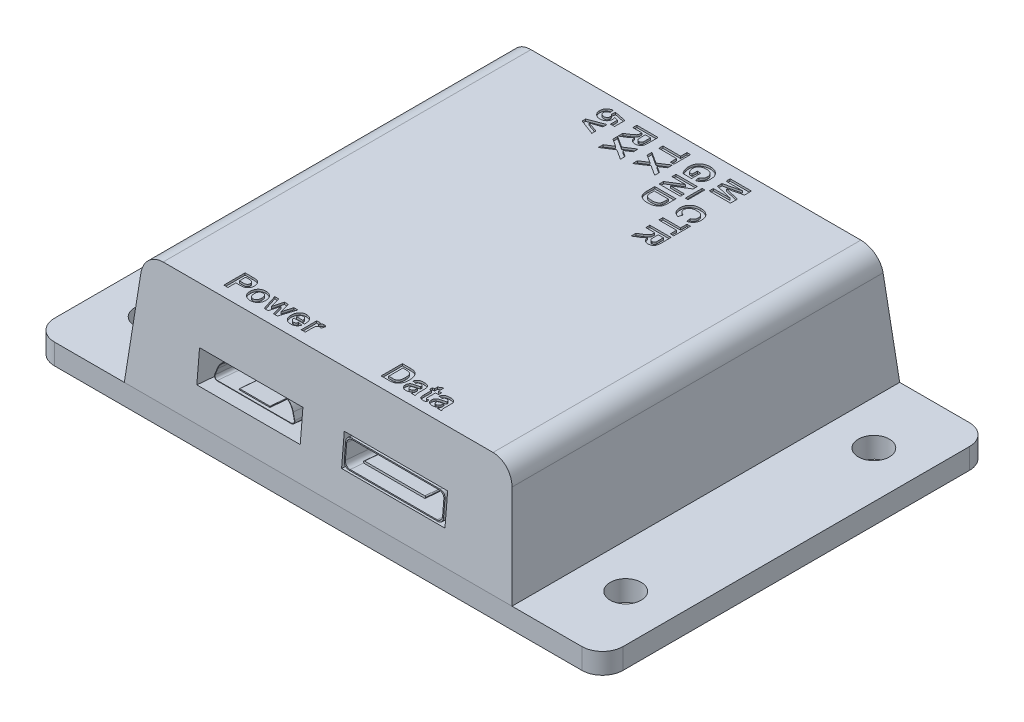
from build123d import *

# Parameters (mm, degrees)
SKETCH1_W           = 37.5
SKETCH1_H           = 37.5
BOSS_EXTRUDE1_DEPTH = 11
BOSS_EXTRUDE1_TAPER = 5
FILLET1_R           = 2
SKETCH2_W           = 55
SKETCH2_H           = 37.5
BOSS_EXTRUDE2_DEPTH = 2
FILLET2_R           = 2
SKETCH3_W           = 10
SKETCH3_H           = 3
CUT_EXTRUDE1_DEPTH  = 4
SKETCH4_W           = 15
SKETCH4_H           = 8
CUT_EXTRUDE2_DEPTH  = 5
BOSS_EXTRUDE3_DEPTH = 4
SKETCH6_W           = 2.92
SKETCH6_H           = 0.02
EXTRUDE_THIN2_DEPTH = 3.5
SKETCH8_W           = 2.92
SKETCH8_H           = 0.02
BOSS_EXTRUDE5_DEPTH = 3.5
SKETCH9_W           = 0.263417301
SKETCH9_H           = 1.633187266
CUT_EXTRUDE3_DEPTH  = 0.2
SKETCH10_R          = 1.5
CUT_EXTRUDE4_DEPTH  = 36.05442206
BOSS_EXTRUDE6_DEPTH = 5


with BuildPart() as part:
    # Sketch1 → Boss-Extrude1 (new body)
    with BuildSketch(Plane(origin=(0, 0, 0), x_dir=(1, 0, 0), z_dir=(0, 1, 0))):
        Rectangle(SKETCH1_W, SKETCH1_H)
    extrude(amount=BOSS_EXTRUDE1_DEPTH, taper=BOSS_EXTRUDE1_TAPER)

    # Fillet1
    fillet1_edges = [part.edges().sort_by_distance(p)[0] for p in [
        (-17.787624701, 11, 0),
        (17.787624701, 11, 0),
    ]]
    fillet(fillet1_edges, radius=FILLET1_R)

    # Sketch2 → Boss-Extrude2 (add)
    with BuildSketch(Plane.XZ):
        Rectangle(SKETCH2_W, SKETCH2_H)
    extrude(amount=BOSS_EXTRUDE2_DEPTH)

    # Fillet2
    fillet2_edges = [part.edges().sort_by_distance(p)[0] for p in [
        (27.5, -1, -18.75),
        (27.5, -1, 18.75),
        (-27.5, -1, -18.75),
        (-27.5, -1, 18.75),
    ]]
    fillet(fillet2_edges, radius=FILLET2_R)

    # Sketch3 → Cut-Extrude1 (cut)
    with BuildSketch(Plane(origin=(0, 1.627951666, 18.607572684), x_dir=(1, 0, 0), z_dir=(0, 0.08715574274765821, 0.9961946980917455))):
        with Locations((-7, 2.907848036)):
            Rectangle(SKETCH3_W, SKETCH3_H)
        with Locations((7, 2.907848036)):
            Rectangle(SKETCH3_W, SKETCH3_H)
    extrude(amount=-CUT_EXTRUDE1_DEPTH, mode=Mode.SUBTRACT)

    # Sketch4 → Cut-Extrude2 (cut)
    with BuildSketch(Plane(origin=(0, 1.627951666, -18.607572684), x_dir=(-1, 0, 0), z_dir=(0, 0.08715574274765821, -0.9961946980917455))):
        with Locations((0, 1.407848036)):
            Rectangle(SKETCH4_W, SKETCH4_H)
    extrude(amount=-CUT_EXTRUDE2_DEPTH, mode=Mode.SUBTRACT)

    # Sketch5 → Boss-Extrude3 (add)
    # profile 1 of 2: a face of its own
    with BuildSketch(Plane(origin=(0, 1.279328695, 14.622793892), x_dir=(1, 0, 0), z_dir=(0, 0.08715574274765818, 0.9961946980917455))):
        with BuildLine():
            Line((2.7, 1.607848036), (11.3, 1.607848036))
            ThreePointArc((11.3, 1.607848036), (11.653553391, 1.754294646), (11.8, 2.107848036))
            Line((11.8, 2.107848036), (11.8, 3.707848036))
            ThreePointArc((11.8, 3.707848036), (11.653553391, 4.061401427), (11.3, 4.207848036))
            Line((11.3, 4.207848036), (2.7, 4.207848036))
            ThreePointArc((2.7, 4.207848036), (2.346446609, 4.061401427), (2.2, 3.707848036))
            Line((2.2, 3.707848036), (2.2, 2.107848036))
            ThreePointArc((2.2, 2.107848036), (2.346446609, 1.754294646), (2.7, 1.607848036))
        make_face()
        with BuildLine():
            ThreePointArc((2.3, 3.607848036), (2.446446609, 3.961401427), (2.8, 4.107848036))
            Line((2.8, 4.107848036), (11.2, 4.107848036))
            ThreePointArc((11.2, 4.107848036), (11.553553391, 3.961401427), (11.7, 3.607848036))
            Line((11.7, 3.607848036), (11.7, 2.207848036))
            ThreePointArc((11.7, 2.207848036), (11.553553391, 1.854294646), (11.2, 1.707848036))
            Line((11.2, 1.707848036), (2.8, 1.707848036))
            ThreePointArc((2.8, 1.707848036), (2.446446609, 1.854294646), (2.3, 2.207848036))
            Line((2.3, 2.207848036), (2.3, 3.607848036))
        make_face(mode=Mode.SUBTRACT)
    # profile 2 of 2: a face of its own
    with BuildSketch(Plane(origin=(0, 1.279328695, 14.622793892), x_dir=(1, 0, 0), z_dir=(0, 0.08715574274765818, 0.9961946980917455))):
        with BuildLine():
            Line((9.91, 3.007848036), (4.09, 3.007848036))
            ThreePointArc((4.09, 3.007848036), (4.02636039, 2.981487647), (4, 2.917848036))
            Line((4, 2.917848036), (4, 2.897848036))
            ThreePointArc((4, 2.897848036), (4.02636039, 2.834208426), (4.09, 2.807848036))
            Line((4.09, 2.807848036), (9.91, 2.807848036))
            ThreePointArc((9.91, 2.807848036), (9.97363961, 2.834208426), (10, 2.897848036))
            Line((10, 2.897848036), (10, 2.917848036))
            ThreePointArc((10, 2.917848036), (9.97363961, 2.981487647), (9.91, 3.007848036))
        make_face()
    extrude(amount=BOSS_EXTRUDE3_DEPTH)

    # Sketch6 → Extrude-Thin2 (add)
    # profile 1 of 2: a face of its own
    with BuildSketch(Plane(origin=(0, 1.279328695, 14.622793892), x_dir=(1, 0, 0), z_dir=(0, 0.08715574274765818, 0.9961946980917455))):
        with BuildLine():
            Line((-10.867296056, 2.603291844), (-10.672062583, 3.185067075))
            ThreePointArc((-10.672062583, 3.185067075), (-10.1258343, 3.925597715), (-9.25, 4.207848036))
            Line((-9.25, 4.207848036), (-4.75, 4.207848036))
            ThreePointArc((-4.75, 4.207848036), (-3.8741657, 3.925597715), (-3.327937417, 3.185067075))
            Line((-3.327937417, 3.185067075), (-3.132703944, 2.603291844))
            ThreePointArc((-3.132703944, 2.603291844), (-3.173566525, 2.332681176), (-3.417116461, 2.207848036))
            Line((-3.417116461, 2.207848036), (-10.582883539, 2.207848036))
            ThreePointArc((-10.582883539, 2.207848036), (-10.826433475, 2.332681176), (-10.867296056, 2.603291844))
        make_face()
        with BuildLine():
            Line((-10.829374387, 2.590566003), (-10.634140914, 3.172341234))
            ThreePointArc((-10.634140914, 3.172341234), (-10.102478718, 3.89312439), (-9.25, 4.167848036))
            Line((-9.25, 4.167848036), (-4.75, 4.167848036))
            ThreePointArc((-4.75, 4.167848036), (-3.897521282, 3.89312439), (-3.365859086, 3.172341234))
            Line((-3.365859086, 3.172341234), (-3.170625613, 2.590566003))
            ThreePointArc((-3.170625613, 2.590566003), (-3.20603985, 2.356036758), (-3.417116461, 2.247848036))
            Line((-3.417116461, 2.247848036), (-10.582883539, 2.247848036))
            ThreePointArc((-10.582883539, 2.247848036), (-10.79396015, 2.356036758), (-10.829374387, 2.590566003))
        make_face(mode=Mode.SUBTRACT)
    # profile 2 of 2: a face of its own
    with BuildSketch(Plane(origin=(0, 1.279328695, 14.622793892), x_dir=(1, 0, 0), z_dir=(0, 0.08715574274765818, 0.9961946980917455))):
        with BuildLine():
            Line((-8.46, 2.603291844), (-5.54, 2.603291844))
            ThreePointArc((-5.54, 2.603291844), (-5.511715729, 2.591576116), (-5.5, 2.563291844))
            Line((-5.5, 2.563291844), (-5.5, 2.543291844))
            ThreePointArc((-5.5, 2.543291844), (-5.511715729, 2.515007573), (-5.54, 2.503291844))
            Line((-5.54, 2.503291844), (-8.46, 2.503291844))
            ThreePointArc((-8.46, 2.503291844), (-8.488284271, 2.515007573), (-8.5, 2.543291844))
            Line((-8.5, 2.543291844), (-8.5, 2.563291844))
            ThreePointArc((-8.5, 2.563291844), (-8.488284271, 2.591576116), (-8.46, 2.603291844))
        make_face()
        with Locations((-7, 2.553291844)):
            Rectangle(SKETCH6_W, SKETCH6_H, mode=Mode.SUBTRACT)
    extrude(amount=EXTRUDE_THIN2_DEPTH)

    # Sketch8 → Boss-Extrude5 (add)
    with BuildSketch(Plane(origin=(0, 1.584373794, 18.109475335), x_dir=(1, 0, 0), z_dir=(0, 0.08715574274765818, 0.9961946980917455))):
        with Locations((-7, 2.553291844)):
            Rectangle(SKETCH8_W, SKETCH8_H)
    extrude(amount=-BOSS_EXTRUDE5_DEPTH)

    # Sketch9 → Cut-Extrude3 (cut)
    # profile 1 of 23: a face of its own
    with BuildSketch(Plane(origin=(0, 11, 0), x_dir=(1, 0, 0), z_dir=(0, 1, 0))):
        with BuildLine():
            Line((-11.082968166, -16.787624701), (-11.082968166, -14.732969753))
            Line((-11.082968166, -14.732969753), (-10.425659682, -14.732969753))
            add(Edge.make_bspline(
                [(-10.425659682, -14.732969753), (-10.395887066, -14.733002266), (-10.338943398, -14.733064452), (-10.257716701, -14.734792216), (-10.184584229, -14.737238058), (-10.119654523, -14.74028425), (-10.062699112, -14.744829753), (-10.013973492, -14.750093378), (-9.97317084, -14.755755641), (-9.949143368, -14.761615326), (-9.938337675, -14.764250558)],
                knots=[0, 0, 0, 0, 1.460485487, 2.793352117, 3.985295279, 5.050041172, 5.981765236, 6.787433016, 7.454681457, 8, 8, 8, 8], degree=3))
            add(Edge.make_bspline(
                [(-9.938337675, -14.764250558), (-9.923968731, -14.768347697), (-9.895449744, -14.77647956), (-9.854590929, -14.793815398), (-9.815209501, -14.81390671), (-9.777800246, -14.837851922), (-9.742235998, -14.865225923), (-9.708411044, -14.895805473), (-9.676145, -14.929728615), (-9.645884226, -14.966928336), (-9.618168916, -15.007217056), (-9.594215925, -15.050654341), (-9.574148326, -15.09705139), (-9.557051066, -15.146059534), (-9.544436626, -15.198204221), (-9.535608811, -15.253123144), (-9.52946355, -15.310840322), (-9.529028447, -15.350337252), (-9.52880609, -15.37052194)],
                knots=[0, 0, 0, 0, 0.907145743, 1.80047177, 2.69161667, 3.591261238, 4.495029544, 5.415863088, 6.359363025, 7.337192411, 8.326890979, 9.326929023, 10.346104993, 11.395420813, 12.477187422, 13.601053412, 14.774031606, 16, 16, 16, 16], degree=3))
            add(Edge.make_bspline(
                [(-9.52880609, -15.37052194), (-9.529440251, -15.401174683), (-9.530661047, -15.460182896), (-9.544319588, -15.544778321), (-9.565152223, -15.622050789), (-9.595600624, -15.691256005), (-9.63272355, -15.752665542), (-9.673615217, -15.808025949), (-9.720307492, -15.855668608), (-9.770754376, -15.896362384), (-9.824067513, -15.929664482), (-9.877477157, -15.958054047), (-9.931703994, -15.979880852), (-9.968675731, -15.989390967), (-9.98690524, -15.994080082)],
                knots=[0, 0, 0, 0, 1.312386234, 2.526415563, 3.661883817, 4.733421185, 5.753802465, 6.732107337, 7.675884281, 8.604170108, 9.50284679, 10.365392406, 11.194030444, 12, 12, 12, 12], degree=3))
            add(Edge.make_bspline(
                [(-9.98690524, -15.994080082), (-9.999916569, -15.996555143), (-10.0273429, -16.001772275), (-10.070839419, -16.006972807), (-10.118383472, -16.012729228), (-10.170170611, -16.01648389), (-10.226138186, -16.019999973), (-10.286264465, -16.021660032), (-10.350463522, -16.023660066), (-10.394651289, -16.023696004), (-10.417427891, -16.023714528)],
                knots=[0, 0, 0, 0, 0.735353946, 1.55003838, 2.431865514, 3.394945452, 4.432993119, 5.54609699, 6.735134699, 8, 8, 8, 8], degree=3))
            Line((-10.417427891, -16.023714528), (-10.687842214, -16.023714528))
            Line((-10.687842214, -16.023714528), (-10.687842214, -16.787624701))
            Line((-10.687842214, -16.787624701), (-11.082968166, -16.787624701))
        make_face()
        with BuildLine():
            Line((-10.687842214, -15.075412245), (-10.687842214, -15.681272037))
            Line((-10.687842214, -15.681272037), (-10.450766643, -15.681272037))
            add(Edge.make_bspline(
                [(-10.450766643, -15.681272037), (-10.430322568, -15.681245564), (-10.391210479, -15.681194917), (-10.335093307, -15.679376992), (-10.28429599, -15.677157877), (-10.238712389, -15.673484788), (-10.198617658, -15.668643745), (-10.163743292, -15.662853248), (-10.134048646, -15.65663944), (-10.10193793, -15.646342163), (-10.067605154, -15.629682109), (-10.030941784, -15.605737426), (-9.998733057, -15.577108734), (-9.971931127, -15.543485327), (-9.950522319, -15.506127773), (-9.935193597, -15.465418925), (-9.925295855, -15.422033472), (-9.924391787, -15.391979244), (-9.923932041, -15.376695783)],
                knots=[0, 0, 0, 0, 1.411705958, 2.700771114, 3.876961699, 4.922619712, 5.858038221, 6.66485904, 7.363650596, 7.950905807, 8.989198271, 9.987739806, 10.967313358, 11.951275539, 12.944273208, 13.927870418, 14.946261014, 16, 16, 16, 16], degree=3))
            add(Edge.make_bspline(
                [(-9.923932041, -15.376695783), (-9.924579083, -15.358080766), (-9.92583361, -15.321988702), (-9.93966755, -15.27058758), (-9.961011738, -15.223940439), (-9.991527867, -15.183498681), (-10.028390633, -15.149490489), (-10.069822843, -15.121194464), (-10.116709301, -15.10139269), (-10.149892346, -15.093720234), (-10.166769866, -15.089817878)],
                knots=[0, 0, 0, 0, 1.085904563, 2.105425768, 3.088705091, 4.068969419, 5.045188284, 6.010769642, 6.988240112, 8, 8, 8, 8], degree=3))
            add(Edge.make_bspline(
                [(-10.166769866, -15.089817878), (-10.174032648, -15.088656255), (-10.190153773, -15.086077813), (-10.216950363, -15.083386888), (-10.248650733, -15.080939494), (-10.285293095, -15.07893011), (-10.326732208, -15.077359238), (-10.373104757, -15.075982766), (-10.42428861, -15.075872184), (-10.460096341, -15.075569806), (-10.478754732, -15.075412245)],
                knots=[0, 0, 0, 0, 0.564603001, 1.253243608, 2.066786758, 3.005752288, 4.070476343, 5.250658742, 6.567396469, 8, 8, 8, 8], degree=3))
            Line((-10.478754732, -15.075412245), (-10.687842214, -15.075412245))
        make_face(mode=Mode.SUBTRACT)
    # profile 2 of 23: a face of its own
    with BuildSketch(Plane(origin=(0, 11, 0), x_dir=(1, 0, 0), z_dir=(0, 1, 0))):
        with BuildLine():
            add(Edge.make_bspline(
                [(-9.291730519, -16.015894327), (-9.290462826, -15.983443293), (-9.287924982, -15.918478323), (-9.269797491, -15.821976259), (-9.239113872, -15.727411385), (-9.204768301, -15.650685212), (-9.17085543, -15.592028576), (-9.143468624, -15.549730968), (-9.112894242, -15.510610993), (-9.07975806, -15.474420741), (-9.044805464, -15.440292615), (-9.006805727, -15.409482103), (-8.966250317, -15.381458291), (-8.923535227, -15.355912027), (-8.878721522, -15.333481712), (-8.832641174, -15.313543439), (-8.78510797, -15.297160903), (-8.73645309, -15.283575188), (-8.686465557, -15.272678963), (-8.635131582, -15.265545039), (-8.582513332, -15.260788169), (-8.547038517, -15.260135311), (-8.529055114, -15.259804355)],
                knots=[0, 0, 0, 0, 1.619840069, 3.242819969, 4.882696853, 6.574901176, 7.427927767, 8.263869039, 9.088735507, 9.903385011, 10.712399333, 11.525463381, 12.34252837, 13.171904741, 14.008210778, 14.842888174, 15.67691885, 16.516221154, 17.363978437, 18.229048737, 19.10224397, 20, 20, 20, 20], degree=3))
            add(Edge.make_bspline(
                [(-8.529055114, -15.259804355), (-8.501720608, -15.260388952), (-8.44794804, -15.261538973), (-8.369228036, -15.27201431), (-8.294391215, -15.2892722), (-8.223336587, -15.313302233), (-8.156010593, -15.34410686), (-8.092751892, -15.382396532), (-8.033037848, -15.427047851), (-7.977998664, -15.478333167), (-7.92769031, -15.534487507), (-7.884058302, -15.595195642), (-7.846817813, -15.659283225), (-7.81597446, -15.726852138), (-7.79256245, -15.798258967), (-7.776388126, -15.873328914), (-7.765557301, -15.951783538), (-7.764466217, -16.005429938), (-7.763910173, -16.032769498)],
                knots=[0, 0, 0, 0, 1.076054793, 2.116819909, 3.120736197, 4.09633837, 5.065772102, 6.030360709, 7.002891056, 7.996945094, 8.988102315, 9.967288529, 10.93568283, 11.902870597, 12.887008047, 13.888537105, 14.923945207, 16, 16, 16, 16], degree=3))
            add(Edge.make_bspline(
                [(-7.763910173, -16.032769498), (-7.764468431, -16.060382183), (-7.765561275, -16.114436662), (-7.776327607, -16.193619764), (-7.792975585, -16.269353226), (-7.816865506, -16.341483428), (-7.847642749, -16.409927616), (-7.88472138, -16.474919577), (-7.929083659, -16.536117519), (-7.979879113, -16.592883603), (-8.035629302, -16.644449587), (-8.094914507, -16.690290895), (-8.158450078, -16.728082737), (-8.22512149, -16.759861586), (-8.295614693, -16.783977994), (-8.369528063, -16.801179882), (-8.446805237, -16.812398783), (-8.499655123, -16.81343726), (-8.526585577, -16.813966431)],
                knots=[0, 0, 0, 0, 1.084306555, 2.122634113, 3.133511532, 4.127271514, 5.10202058, 6.077484774, 7.061903265, 8.065960046, 9.065303363, 10.042062392, 11.004391854, 11.964060687, 12.939122686, 13.924942149, 14.942623041, 16, 16, 16, 16], degree=3))
            add(Edge.make_bspline(
                [(-8.526585577, -16.813966431), (-8.560135285, -16.812867404), (-8.626995983, -16.810677168), (-8.725935759, -16.792711848), (-8.822431674, -16.763725648), (-8.900173538, -16.730361485), (-8.959559788, -16.697827022), (-9.001674985, -16.670440576), (-9.041393388, -16.641049849), (-9.077785655, -16.608143288), (-9.111479873, -16.572665792), (-9.142922398, -16.534960865), (-9.170993669, -16.494158194), (-9.196477756, -16.450999091), (-9.219344933, -16.405175076), (-9.238408015, -16.356560261), (-9.254970352, -16.305725661), (-9.26863042, -16.252555844), (-9.278759245, -16.196822817), (-9.286123891, -16.138705162), (-9.290738956, -16.078118252), (-9.291395887, -16.036893637), (-9.291730519, -16.015894327)],
                knots=[0, 0, 0, 0, 1.610846835, 3.210231987, 4.81374032, 6.443368681, 7.263437361, 8.06418174, 8.855100662, 9.634539345, 10.417731031, 11.204243685, 11.990424874, 12.794120493, 13.610605693, 14.447765341, 15.300248309, 16.177865431, 17.082777535, 18.019649293, 18.991233806, 20, 20, 20, 20], degree=3))
        make_face()
        with BuildLine():
            add(Edge.make_bspline(
                [(-8.896604567, -16.036885393), (-8.896311727, -16.05596817), (-8.895741859, -16.093103258), (-8.890662805, -16.14713247), (-8.88279053, -16.197869003), (-8.870633549, -16.244841208), (-8.855973422, -16.288683831), (-8.837363989, -16.32881376), (-8.816099395, -16.365991012), (-8.79079215, -16.398824899), (-8.763209709, -16.427889459), (-8.734300632, -16.453714959), (-8.703781374, -16.475705196), (-8.671464485, -16.493583818), (-8.63738991, -16.507156507), (-8.60195978, -16.51711607), (-8.564919279, -16.522967019), (-8.539776915, -16.523789392), (-8.526997167, -16.5242074)],
                knots=[0, 0, 0, 0, 1.334287467, 2.596523749, 3.792235791, 4.920928783, 5.98599801, 7.020725633, 8.009778093, 8.975087571, 9.91178927, 10.809031968, 11.682407688, 12.537028737, 13.385161363, 14.241880569, 15.106355953, 16, 16, 16, 16], degree=3))
            add(Edge.make_bspline(
                [(-8.526997167, -16.5242074), (-8.514216865, -16.523790764), (-8.489073411, -16.52297109), (-8.452040856, -16.517100462), (-8.416703847, -16.50724849), (-8.382849956, -16.493472916), (-8.350616682, -16.475721425), (-8.320116429, -16.453700241), (-8.291228202, -16.427995979), (-8.263870058, -16.398774611), (-8.239295001, -16.365493643), (-8.217822027, -16.328432451), (-8.199213169, -16.288148909), (-8.184485305, -16.244073736), (-8.172994593, -16.196560949), (-8.164936252, -16.145494881), (-8.159898196, -16.090904904), (-8.159329381, -16.053360511), (-8.159036124, -16.034004267)],
                knots=[0, 0, 0, 0, 0.891374549, 1.753654511, 2.608197993, 3.445305504, 4.297756158, 5.168913853, 6.063877914, 6.991658187, 7.956416983, 8.942957645, 9.975057474, 11.046479855, 12.179282068, 13.381405243, 14.649967197, 16, 16, 16, 16], degree=3))
            add(Edge.make_bspline(
                [(-8.159036124, -16.034004267), (-8.159330836, -16.015059801), (-8.159902112, -15.97833739), (-8.164911764, -15.924972466), (-8.173104713, -15.874894889), (-8.184397163, -15.828155192), (-8.19928961, -15.78467354), (-8.217938541, -15.7448521), (-8.239153812, -15.70789876), (-8.264013708, -15.674966053), (-8.291210827, -15.645762012), (-8.320120881, -15.620073824), (-8.350615531, -15.598048513), (-8.382850255, -15.580298092), (-8.416703766, -15.566522237), (-8.452040878, -15.556670341), (-8.489073405, -15.550799692), (-8.514216863, -15.549980021), (-8.526997167, -15.549563386)],
                knots=[0, 0, 0, 0, 1.332105243, 2.582185114, 3.76554119, 4.898206757, 5.96011018, 6.991864232, 7.986448439, 8.951336849, 9.886681577, 10.788942532, 11.667203022, 12.526603947, 13.370536632, 14.232047448, 15.101357822, 16, 16, 16, 16], degree=3))
            add(Edge.make_bspline(
                [(-8.526997167, -15.549563386), (-8.539776915, -15.549981395), (-8.564919279, -15.550803768), (-8.60195978, -15.556654717), (-8.63738991, -15.56661428), (-8.671464485, -15.580186968), (-8.703781374, -15.598065591), (-8.734300632, -15.620055827), (-8.763209709, -15.645881327), (-8.79079215, -15.674945887), (-8.816099395, -15.707779774), (-8.837363989, -15.744957026), (-8.855973422, -15.785086956), (-8.870633549, -15.828929579), (-8.88279053, -15.875901784), (-8.890662805, -15.926638316), (-8.895741859, -15.980667529), (-8.896311727, -16.017802617), (-8.896604567, -16.036885393)],
                knots=[0, 0, 0, 0, 0.893644047, 1.758119431, 2.614838637, 3.462971263, 4.317592312, 5.190968032, 6.08821073, 7.024912429, 7.990221907, 8.979274367, 10.01400199, 11.079071217, 12.207764209, 13.403476251, 14.665712533, 16, 16, 16, 16], degree=3))
        make_face(mode=Mode.SUBTRACT)
    # profile 3 of 23: a face of its own
    with BuildSketch(Plane(origin=(0, 11, 0), x_dir=(1, 0, 0), z_dir=(0, 1, 0))):
        Polygon((-7.180276215, -16.787624701), (-7.658543253, -15.286146085), (-7.270002734, -15.286146085), (-6.986829135, -16.270256658), (-6.728350908, -15.286146085), (-6.343514695, -15.286146085), (-6.091210311, -16.270256658), (-5.807213534, -15.286146085), (-5.419496194, -15.286146085), (-5.896528462, -16.787624701), (-6.278071959, -16.787624701), (-6.539019723, -15.822035657), (-6.793382055, -16.787624701), align=None)
    # profile 4 of 23: a face of its own
    with BuildSketch(Plane(origin=(0, 11, 0), x_dir=(1, 0, 0), z_dir=(0, 1, 0))):
        with BuildLine():
            Line((-4.33948526, -16.313473559), (-3.944359308, -16.36615702))
            add(Edge.make_bspline(
                [(-3.944359308, -16.36615702), (-3.950822145, -16.383959495), (-3.963529461, -16.418962957), (-3.986745809, -16.468873678), (-4.012697117, -16.515456025), (-4.041258622, -16.558958886), (-4.072324031, -16.599439019), (-4.106920557, -16.636044894), (-4.14336282, -16.670139226), (-4.183175182, -16.700098553), (-4.225360091, -16.727041921), (-4.270129544, -16.750617083), (-4.317841574, -16.769816951), (-4.367773664, -16.785895541), (-4.420152464, -16.798729492), (-4.475191667, -16.807701686), (-4.53282066, -16.813152926), (-4.572158295, -16.813691846), (-4.592201233, -16.813966431)],
                knots=[0, 0, 0, 0, 1.071172907, 2.106154283, 3.1104349, 4.085737425, 5.048416355, 5.993087888, 6.932482331, 7.868664062, 8.80754521, 9.762367971, 10.726735429, 11.713584758, 12.728370439, 13.774815933, 14.866245336, 16, 16, 16, 16], degree=3))
            add(Edge.make_bspline(
                [(-4.592201233, -16.813966431), (-4.62352168, -16.813193384), (-4.684343604, -16.811692186), (-4.772338795, -16.799628507), (-4.854067618, -16.779987338), (-4.929687482, -16.752476056), (-4.998947043, -16.71638816), (-5.06195059, -16.672506066), (-5.118821682, -16.620734405), (-5.150698019, -16.5806504), (-5.166780221, -16.560427279)],
                knots=[0, 0, 0, 0, 1.150944905, 2.235047425, 3.25761485, 4.235688044, 5.185329112, 6.119879054, 7.051444229, 8, 8, 8, 8], degree=3))
            add(Edge.make_bspline(
                [(-5.166780221, -16.560427279), (-5.178648889, -16.543217525), (-5.202548923, -16.508562105), (-5.232257543, -16.452408137), (-5.257660898, -16.393087503), (-5.277898809, -16.330430284), (-5.294722121, -16.264674547), (-5.306041075, -16.195402548), (-5.312564975, -16.122759659), (-5.313600786, -16.073255899), (-5.314129274, -16.047998311)],
                knots=[0, 0, 0, 0, 0.92479112, 1.862259343, 2.806490716, 3.778329015, 4.774107667, 5.808532634, 6.881879269, 8, 8, 8, 8], degree=3))
            add(Edge.make_bspline(
                [(-5.314129274, -16.047998311), (-5.313694631, -16.018057723), (-5.312844952, -15.959527091), (-5.30278543, -15.874443604), (-5.288590868, -15.793985757), (-5.266943204, -15.718989421), (-5.23988652, -15.648599111), (-5.205929331, -15.583720012), (-5.166760654, -15.523171984), (-5.12096352, -15.468783647), (-5.070775457, -15.419879999), (-5.017365943, -15.37678768), (-4.960335151, -15.340794193), (-4.900532539, -15.310752366), (-4.836963037, -15.288265393), (-4.770422274, -15.271712028), (-4.700619312, -15.261631251), (-4.653012549, -15.260419708), (-4.628832701, -15.259804355)],
                knots=[0, 0, 0, 0, 1.222152375, 2.389176539, 3.494777592, 4.555389183, 5.572001132, 6.56945427, 7.540785438, 8.511469914, 9.46642023, 10.399267108, 11.30862844, 12.215760073, 13.126777173, 14.056336669, 15.012798191, 16, 16, 16, 16], degree=3))
            add(Edge.make_bspline(
                [(-4.628832701, -15.259804355), (-4.601770544, -15.260376527), (-4.548812738, -15.261496207), (-4.47160045, -15.272007657), (-4.398698764, -15.289104778), (-4.330345813, -15.31367236), (-4.266095879, -15.344478917), (-4.206426809, -15.382657423), (-4.15133554, -15.427859223), (-4.100958122, -15.480065043), (-4.0553657, -15.538931605), (-4.016559441, -15.605594401), (-3.984073239, -15.679364413), (-3.957736237, -15.760431832), (-3.938265599, -15.848966374), (-3.924942975, -15.944737635), (-3.917345302, -16.047736827), (-3.917788814, -16.118779302), (-3.918017578, -16.155423179)],
                knots=[0, 0, 0, 0, 0.994942504, 1.946998194, 2.860087576, 3.744358974, 4.613292, 5.475605888, 6.343365869, 7.228414471, 8.138836547, 9.075277299, 10.058013037, 11.098483422, 12.205225682, 13.387753975, 14.652597341, 16, 16, 16, 16], degree=3))
            Line((-3.918017578, -16.155423179), (-4.919003322, -16.155423179))
            add(Edge.make_bspline(
                [(-4.919003322, -16.155423179), (-4.918355318, -16.169565748), (-4.917093448, -16.197105868), (-4.912313591, -16.237362081), (-4.904038841, -16.275043756), (-4.893209874, -16.310379504), (-4.880333178, -16.343394119), (-4.863953002, -16.373770578), (-4.845080932, -16.401896405), (-4.82326363, -16.42731295), (-4.799375465, -16.449875369), (-4.774168071, -16.46970346), (-4.747680141, -16.487041551), (-4.719227341, -16.500228276), (-4.689755641, -16.511362978), (-4.658734492, -16.518500161), (-4.626371527, -16.523242805), (-4.604292267, -16.523881467), (-4.593024412, -16.5242074)],
                knots=[0, 0, 0, 0, 1.231756261, 2.398624542, 3.522625857, 4.583815436, 5.612473245, 6.600564899, 7.580690863, 8.554470542, 9.508734211, 10.435415665, 11.342824763, 12.255949018, 13.158633635, 14.07945191, 15.019874036, 16, 16, 16, 16], degree=3))
            add(Edge.make_bspline(
                [(-4.593024412, -16.5242074), (-4.578026981, -16.523542408), (-4.548979194, -16.522254416), (-4.507108764, -16.513230119), (-4.469118372, -16.497326906), (-4.43460994, -16.475155941), (-4.403904309, -16.445712871), (-4.378160818, -16.408211171), (-4.355652546, -16.363821604), (-4.34505167, -16.330808433), (-4.33948526, -16.313473559)],
                knots=[0, 0, 0, 0, 1.004430367, 1.945431754, 2.851730883, 3.749038912, 4.678525969, 5.68064125, 6.782128749, 8, 8, 8, 8], degree=3))
        make_face()
        with BuildLine():
            add(Edge.make_bspline(
                [(-4.31314353, -15.918347608), (-4.313823566, -15.903796491), (-4.315147984, -15.875457176), (-4.319468192, -15.834138523), (-4.326884523, -15.795626574), (-4.336639174, -15.759713631), (-4.349654913, -15.726841797), (-4.36418635, -15.696068916), (-4.382007303, -15.668353183), (-4.402421484, -15.643758277), (-4.423955266, -15.621277739), (-4.447758949, -15.602583716), (-4.471827278, -15.585853972), (-4.497405165, -15.572467352), (-4.524227632, -15.562239965), (-4.55220435, -15.554720528), (-4.581384187, -15.550691297), (-4.60110797, -15.549943514), (-4.611134351, -15.549563386)],
                knots=[0, 0, 0, 0, 1.317025077, 2.564998298, 3.752245872, 4.859831213, 5.924126069, 6.944952788, 7.932526842, 8.893486968, 9.832088588, 10.740700482, 11.624936399, 12.479435602, 13.343337491, 14.21592381, 15.09308328, 16, 16, 16, 16], degree=3))
            add(Edge.make_bspline(
                [(-4.611134351, -15.549563386), (-4.621849279, -15.549911196), (-4.642963579, -15.550596573), (-4.673927071, -15.555068529), (-4.703275927, -15.563000324), (-4.731233814, -15.573735606), (-4.757740819, -15.587872849), (-4.782797534, -15.605210433), (-4.806498224, -15.625531295), (-4.820778976, -15.640926569), (-4.828042035, -15.648756464)],
                knots=[0, 0, 0, 0, 1.043516863, 2.056302107, 3.038302912, 3.998520634, 4.966791607, 5.956307719, 6.960596886, 8, 8, 8, 8], degree=3))
            add(Edge.make_bspline(
                [(-4.828042035, -15.648756464), (-4.834811694, -15.657268692), (-4.848412783, -15.674370818), (-4.865662974, -15.702726824), (-4.880689089, -15.733036074), (-4.891886809, -15.766116887), (-4.90172068, -15.800897185), (-4.907489168, -15.838208175), (-4.911375083, -15.877516054), (-4.91179192, -15.904480027), (-4.9120063, -15.918347608)],
                knots=[0, 0, 0, 0, 0.903873942, 1.815995408, 2.755131859, 3.711650387, 4.716574161, 5.757841734, 6.846857195, 8, 8, 8, 8], degree=3))
            Line((-4.9120063, -15.918347608), (-4.31314353, -15.918347608))
        make_face(mode=Mode.SUBTRACT)
    # profile 5 of 23: a face of its own
    with BuildSketch(Plane(origin=(0, 11, 0), x_dir=(1, 0, 0), z_dir=(0, 1, 0))):
        with BuildLine():
            Line((-3.206790865, -16.787624701), (-3.601916817, -16.787624701))
            Line((-3.601916817, -16.787624701), (-3.601916817, -15.286146085))
            Line((-3.601916817, -15.286146085), (-3.206790865, -15.286146085))
            Line((-3.206790865, -15.286146085), (-3.206790865, -15.495645158))
            add(Edge.make_bspline(
                [(-3.206790865, -15.495645158), (-3.199963762, -15.483827462), (-3.186792665, -15.461028335), (-3.167309254, -15.428514976), (-3.147920312, -15.399538628), (-3.128805379, -15.374098985), (-3.111081953, -15.351241759), (-3.093050861, -15.332256716), (-3.076110704, -15.315945025), (-3.053445136, -15.299638368), (-3.024355917, -15.283723476), (-2.987794623, -15.26941775), (-2.948638578, -15.261598912), (-2.92200298, -15.260411361), (-2.908388454, -15.259804355)],
                knots=[0, 0, 0, 0, 1.218987753, 2.351715484, 3.384890168, 4.330893419, 5.1939795, 5.965577503, 6.66790098, 7.29043559, 8.453252551, 9.620708942, 10.783848683, 12, 12, 12, 12], degree=3))
            add(Edge.make_bspline(
                [(-2.908388454, -15.259804355), (-2.888677269, -15.260910966), (-2.849087827, -15.263133567), (-2.790439567, -15.279009242), (-2.733414943, -15.305883192), (-2.69814979, -15.330332091), (-2.679956263, -15.342945441)],
                knots=[0, 0, 0, 0, 0.956058025, 1.920219652, 2.927027487, 4, 4, 4, 4], degree=3))
            Line((-2.679956263, -15.342945441), (-2.772152319, -15.718726684))
            add(Edge.make_bspline(
                [(-2.772152319, -15.718726684), (-2.787692532, -15.708952798), (-2.817299632, -15.690331663), (-2.863512678, -15.670549034), (-2.907961743, -15.657597348), (-2.937395102, -15.655798689), (-2.951605355, -15.654930307)],
                knots=[0, 0, 0, 0, 1.139741959, 2.17142794, 3.117176162, 4, 4, 4, 4], degree=3))
            add(Edge.make_bspline(
                [(-2.951605355, -15.654930307), (-2.964412336, -15.655477397), (-2.989344073, -15.656542435), (-3.025234464, -15.665024195), (-3.058323288, -15.678689572), (-3.088742094, -15.698333837), (-3.115945686, -15.725809296), (-3.139365713, -15.762004626), (-3.158966457, -15.807253874), (-3.173947763, -15.851175154), (-3.183289175, -15.893864956), (-3.189876879, -15.93451428), (-3.194882217, -15.983177463), (-3.199464249, -16.039707024), (-3.202535609, -16.104227902), (-3.204953487, -16.176536988), (-3.206699831, -16.256803168), (-3.206759597, -16.312923778), (-3.206790865, -16.342284827)],
                knots=[0, 0, 0, 0, 0.752818562, 1.4655346, 2.15662141, 2.850671748, 3.581264886, 4.414089304, 5.371394652, 6.476667933, 7.138571115, 7.940099809, 8.898357565, 10.015825393, 11.276710544, 12.698206094, 14.272575274, 16, 16, 16, 16], degree=3))
            Line((-3.206790865, -16.342284827), (-3.206790865, -16.787624701))
        make_face()
    # profile 6 of 23: a face of its own
    with BuildSketch(Plane(origin=(0, 11, 0), x_dir=(1, 0, 0), z_dir=(0, 1, 0))):
        with BuildLine():
            Line((8.975629758, -15.733955497), (8.633187266, -15.681272037))
            add(Edge.make_bspline(
                [(8.633187266, -15.681272037), (8.638319261, -15.663915308), (8.648365035, -15.629939864), (8.666799193, -15.581252745), (8.688385405, -15.536241546), (8.712191935, -15.494368534), (8.738952343, -15.456091463), (8.768238918, -15.421310758), (8.800217173, -15.390145458), (8.835039941, -15.362354288), (8.873377175, -15.337666307), (8.916099137, -15.316735812), (8.963141799, -15.299112038), (9.01443911, -15.284948699), (9.069905008, -15.273107599), (9.129964038, -15.265858657), (9.194228827, -15.260626047), (9.238486319, -15.260083627), (9.261272893, -15.259804355)],
                knots=[0, 0, 0, 0, 1.047140172, 2.049755565, 3.008539736, 3.933190086, 4.833981818, 5.707167246, 6.560530269, 7.413560864, 8.281243119, 9.193714071, 10.161006392, 11.183910126, 12.270717139, 13.439589873, 14.681737877, 16, 16, 16, 16], degree=3))
            add(Edge.make_bspline(
                [(9.261272893, -15.259804355), (9.281993297, -15.259919396), (9.322084023, -15.260141982), (9.380163642, -15.263060182), (9.434152459, -15.267845219), (9.483979835, -15.274918351), (9.529809991, -15.283329481), (9.571496562, -15.293995714), (9.609163653, -15.306583058), (9.652685527, -15.326149834), (9.70049175, -15.353646129), (9.750387872, -15.390981318), (9.790419577, -15.433451945), (9.816912944, -15.47309049), (9.832558865, -15.509018395), (9.843599162, -15.540672995), (9.851531689, -15.577658159), (9.85933917, -15.619444346), (9.864130376, -15.66625765), (9.868454306, -15.718109561), (9.870796093, -15.774956341), (9.871094013, -15.814625389), (9.871248581, -15.835206522)],
                knots=[0, 0, 0, 0, 1.253259065, 2.424859341, 3.516580225, 4.530621704, 5.468151732, 6.333678254, 7.13150538, 7.867126506, 9.216626747, 10.459871386, 11.622324159, 12.731817101, 13.322505456, 13.989117254, 14.756090433, 15.607496751, 16.559714447, 17.600403876, 18.755039204, 20, 20, 20, 20], degree=3))
            Line((9.871248581, -15.835206522), (9.871248581, -16.296598389))
            add(Edge.make_bspline(
                [(9.871248581, -16.296598389), (9.871376571, -16.312512683), (9.871623741, -16.343245725), (9.872130417, -16.387722718), (9.874424678, -16.428871926), (9.876835104, -16.466744051), (9.879612126, -16.501486856), (9.883215876, -16.532939962), (9.887725409, -16.561239546), (9.894960336, -16.595037785), (9.90659812, -16.63604419), (9.925626068, -16.685196769), (9.948451638, -16.736393596), (9.967031771, -16.770191543), (9.976615501, -16.787624701)],
                knots=[0, 0, 0, 0, 1.124218554, 2.171045354, 3.141373911, 4.034856482, 4.851737235, 5.603038048, 6.270604849, 6.87504238, 8.043824301, 9.276776929, 10.59534724, 12, 12, 12, 12], degree=3))
            Line((9.976615501, -16.787624701), (9.58148955, -16.787624701))
            add(Edge.make_bspline(
                [(9.58148955, -16.787624701), (9.578669307, -16.779691964), (9.572489577, -16.76230971), (9.564143829, -16.733172413), (9.554141995, -16.699223929), (9.547547705, -16.674727593), (9.544034902, -16.661678304)],
                knots=[0, 0, 0, 0, 0.768508203, 1.683958961, 2.766236402, 4, 4, 4, 4], degree=3))
            add(Edge.make_bspline(
                [(9.544034902, -16.661678304), (9.542520457, -16.655917436), (9.539779186, -16.645489791), (9.536126182, -16.631307112), (9.532959233, -16.620464014), (9.530878467, -16.614340841), (9.530040858, -16.611875971)],
                knots=[0, 0, 0, 0, 1.381357368, 2.500370598, 3.396327181, 4, 4, 4, 4], degree=3))
            add(Edge.make_bspline(
                [(9.530040858, -16.611875971), (9.513325313, -16.627991579), (9.480615799, -16.659527116), (9.427269246, -16.700368811), (9.372767792, -16.735528373), (9.316226052, -16.764222598), (9.258069223, -16.786648513), (9.197721551, -16.80228681), (9.135505638, -16.812017415), (9.093242438, -16.813313302), (9.071941708, -16.813966431)],
                knots=[0, 0, 0, 0, 1.082260538, 2.117802027, 3.127898709, 4.103827344, 5.070056335, 6.029309159, 7.006768236, 8, 8, 8, 8], degree=3))
            add(Edge.make_bspline(
                [(9.071941708, -16.813966431), (9.053408641, -16.813537453), (9.017210796, -16.812699593), (8.964390337, -16.80716487), (8.914739813, -16.796667699), (8.868031815, -16.78270691), (8.824153076, -16.765155476), (8.783482716, -16.74310363), (8.745782142, -16.717045791), (8.71142556, -16.687077366), (8.680633076, -16.654185493), (8.653609203, -16.619188707), (8.631253686, -16.581617686), (8.612759068, -16.542196693), (8.598126096, -16.500580607), (8.588032387, -16.456958749), (8.581598328, -16.411211394), (8.580874057, -16.38003605), (8.580503806, -16.364099072)],
                knots=[0, 0, 0, 0, 1.186431605, 2.317277787, 3.39378889, 4.430144672, 5.434756152, 6.413230964, 7.385260177, 8.362630794, 9.325691837, 10.265445477, 11.187216893, 12.118354241, 13.048828682, 14.005299944, 14.980300216, 16, 16, 16, 16], degree=3))
            add(Edge.make_bspline(
                [(8.580503806, -16.364099072), (8.581176274, -16.343191189), (8.582495784, -16.3021659), (8.594023917, -16.242564232), (8.61207641, -16.186264838), (8.637734578, -16.13397394), (8.669661047, -16.086159675), (8.70806892, -16.043955217), (8.752404657, -16.008019623), (8.803636426, -15.977502112), (8.863722917, -15.95179479), (8.933895878, -15.927029678), (9.015863846, -15.904834311), (9.074621822, -15.89213541), (9.10569205, -15.885420445)],
                knots=[0, 0, 0, 0, 0.9565892, 1.877012003, 2.769038917, 3.656897043, 4.535078379, 5.39337207, 6.259743944, 7.138913465, 8.11486349, 9.247429708, 10.544487161, 12, 12, 12, 12], degree=3))
            add(Edge.make_bspline(
                [(9.10569205, -15.885420445), (9.127101637, -15.881063913), (9.168314338, -15.87267774), (9.227514413, -15.860068812), (9.281598329, -15.847359985), (9.330336571, -15.83444937), (9.374244544, -15.82271923), (9.412863987, -15.810898974), (9.446347293, -15.799002482), (9.46668625, -15.790557197), (9.47612263, -15.786638957)],
                knots=[0, 0, 0, 0, 1.365613701, 2.628758346, 3.783158308, 4.837685682, 5.780080249, 6.623655076, 7.36143661, 8, 8, 8, 8], degree=3))
            Line((9.47612263, -15.786638957), (9.47612263, -15.74918431))
            add(Edge.make_bspline(
                [(9.47612263, -15.74918431), (9.475596111, -15.732392872), (9.474618337, -15.701210218), (9.464897638, -15.657970998), (9.44802355, -15.622356643), (9.427655495, -15.598619897), (9.407503313, -15.584300787), (9.38970911, -15.57477093), (9.368857573, -15.567165416), (9.345241595, -15.560424482), (9.318455302, -15.555818138), (9.288807905, -15.551993223), (9.256219931, -15.55011642), (9.233560759, -15.549752769), (9.221760298, -15.549563386)],
                knots=[0, 0, 0, 0, 1.600506204, 2.972230995, 4.195852174, 5.327580964, 5.908906329, 6.547275261, 7.247479517, 8.022494018, 8.887774365, 9.837646189, 10.873887764, 12, 12, 12, 12], degree=3))
            add(Edge.make_bspline(
                [(9.221760298, -15.549563386), (9.206079777, -15.549938072), (9.176282723, -15.550650072), (9.134291586, -15.558616437), (9.097342938, -15.571104076), (9.065316255, -15.589747842), (9.03770683, -15.615075191), (9.01366571, -15.647735546), (8.992367926, -15.687871115), (8.981419043, -15.718016141), (8.975629758, -15.733955497)],
                knots=[0, 0, 0, 0, 1.120680009, 2.129582446, 3.045508635, 3.899130849, 4.760899303, 5.707254252, 6.787697471, 8, 8, 8, 8], degree=3))
        make_face()
        with BuildLine():
            add(Edge.make_bspline(
                [(9.47612263, -16.076397988), (9.462561446, -16.080585807), (9.432018047, -16.090017891), (9.380714007, -16.10387568), (9.31887441, -16.118478643), (9.261847963, -16.131114375), (9.214243099, -16.141377062), (9.180661126, -16.149768063), (9.150399668, -16.157769125), (9.123413472, -16.166171488), (9.09966642, -16.174080873), (9.079504233, -16.182555969), (9.062225131, -16.189977147), (9.052533511, -16.196190004), (9.048069515, -16.199051669)],
                knots=[0, 0, 0, 0, 1.144223484, 2.577096135, 4.283377528, 6.266557578, 7.286341447, 8.209198618, 9.057088726, 9.80932547, 10.487940513, 11.073343897, 11.57317876, 12, 12, 12, 12], degree=3))
            add(Edge.make_bspline(
                [(9.048069515, -16.199051669), (9.037018373, -16.207755603), (9.015809867, -16.224459525), (8.992690138, -16.256739498), (8.978019216, -16.292526633), (8.976435997, -16.317859697), (8.975629758, -16.33076032)],
                knots=[0, 0, 0, 0, 1.075028234, 2.063111864, 3.013658082, 4, 4, 4, 4], degree=3))
            add(Edge.make_bspline(
                [(8.975629758, -16.33076032), (8.976340864, -16.343596164), (8.977735752, -16.368774642), (8.988846082, -16.405055838), (9.007529213, -16.438294998), (9.03297539, -16.467844335), (9.063594841, -16.493426368), (9.099688134, -16.510960475), (9.13945194, -16.522282462), (9.16734807, -16.523549405), (9.181836114, -16.5242074)],
                knots=[0, 0, 0, 0, 0.976809721, 1.916086158, 2.861451878, 3.862738809, 4.873423621, 5.878632484, 6.898253484, 8, 8, 8, 8], degree=3))
            add(Edge.make_bspline(
                [(9.181836114, -16.5242074), (9.198391198, -16.52345831), (9.23171971, -16.52195025), (9.280600363, -16.508171115), (9.328860757, -16.487833311), (9.358164158, -16.467817457), (9.373225246, -16.457529896)],
                knots=[0, 0, 0, 0, 0.962503947, 1.937702252, 2.940039444, 4, 4, 4, 4], degree=3))
            add(Edge.make_bspline(
                [(9.373225246, -16.457529896), (9.383861943, -16.448966678), (9.40454329, -16.432316878), (9.429192551, -16.401890964), (9.449533654, -16.369525047), (9.45764042, -16.345648187), (9.461716996, -16.333641446)],
                knots=[0, 0, 0, 0, 1.055399509, 2.052054707, 3.020454315, 4, 4, 4, 4], degree=3))
            add(Edge.make_bspline(
                [(9.461716996, -16.333641446), (9.46396375, -16.323795107), (9.469223106, -16.300746118), (9.472933709, -16.260169405), (9.475935354, -16.20911608), (9.476056405, -16.171483479), (9.47612263, -16.150895694)],
                knots=[0, 0, 0, 0, 0.659054705, 1.542760655, 2.655710416, 4, 4, 4, 4], degree=3))
            Line((9.47612263, -16.150895694), (9.47612263, -16.076397988))
        make_face(mode=Mode.SUBTRACT)
    # profile 7 of 23: a face of its own
    with BuildSketch(Plane(origin=(0, 11, 0), x_dir=(1, 0, 0), z_dir=(0, 1, 0))):
        with BuildLine():
            Line((8.475136886, -15.286146085), (8.475136886, -15.575905117))
            Line((8.475136886, -15.575905117), (8.185377855, -15.575905117))
            Line((8.185377855, -15.575905117), (8.185377855, -16.221277504))
            add(Edge.make_bspline(
                [(8.185377855, -16.221277504), (8.185347788, -16.236780741), (8.185291112, -16.266004343), (8.185663962, -16.307303909), (8.186540288, -16.343522198), (8.187450276, -16.374660964), (8.187907989, -16.400762239), (8.189686922, -16.421609326), (8.191302962, -16.437383652), (8.193810967, -16.456810511), (8.205330963, -16.480312301), (8.224463856, -16.500852697), (8.244131733, -16.512775919), (8.260826985, -16.519353308), (8.279005799, -16.52364715), (8.291680439, -16.524018004), (8.298153387, -16.5242074)],
                knots=[0, 0, 0, 0, 1.772607892, 3.341365874, 4.72216035, 5.914769548, 6.903535532, 7.706019004, 8.305410619, 8.718065781, 9.939723765, 11.215765275, 11.877591902, 12.553399735, 13.261220211, 14, 14, 14, 14], degree=3))
            add(Edge.make_bspline(
                [(8.298153387, -16.5242074), (8.308743278, -16.523608473), (8.332161342, -16.522284028), (8.370156838, -16.514674604), (8.414193669, -16.502564504), (8.445282613, -16.492006796), (8.461966021, -16.486341163)],
                knots=[0, 0, 0, 0, 0.753421026, 1.666085143, 2.747540144, 4, 4, 4, 4], degree=3))
            Line((8.461966021, -16.486341163), (8.501478616, -16.761694561))
            add(Edge.make_bspline(
                [(8.501478616, -16.761694561), (8.477484176, -16.769926161), (8.42867304, -16.786671447), (8.350925077, -16.801906079), (8.268938854, -16.812253768), (8.212578247, -16.813386613), (8.183731496, -16.813966431)],
                knots=[0, 0, 0, 0, 0.939547081, 1.911291127, 2.930947196, 4, 4, 4, 4], degree=3))
            add(Edge.make_bspline(
                [(8.183731496, -16.813966431), (8.166014952, -16.813440008), (8.131417996, -16.812412007), (8.0807567, -16.805896091), (8.032906087, -16.794342725), (7.988210027, -16.778418771), (7.947845078, -16.758850684), (7.912293719, -16.736885972), (7.883131517, -16.711332488), (7.858771958, -16.683128159), (7.839558254, -16.650379308), (7.824304602, -16.613112698), (7.811195386, -16.5711642), (7.805825117, -16.541162565), (7.803011179, -16.525442169)],
                knots=[0, 0, 0, 0, 1.203015215, 2.349253984, 3.460901624, 4.539344044, 5.564274864, 6.502382232, 7.367332183, 8.186789841, 9.022345106, 9.932420497, 10.916620053, 12, 12, 12, 12], degree=3))
            add(Edge.make_bspline(
                [(7.803011179, -16.525442169), (7.802024513, -16.518860738), (7.799829349, -16.504218163), (7.796850984, -16.479955862), (7.795013214, -16.451097405), (7.793507226, -16.417746111), (7.791575424, -16.37989493), (7.79116699, -16.337617891), (7.789984887, -16.290841415), (7.79015996, -16.258184348), (7.790251903, -16.241033802)],
                knots=[0, 0, 0, 0, 0.560521704, 1.24706641, 2.057998689, 2.995119087, 4.059211621, 5.249632546, 6.555586685, 8, 8, 8, 8], degree=3))
            Line((7.790251903, -16.241033802), (7.790251903, -15.575905117))
            Line((7.790251903, -15.575905117), (7.605859792, -15.575905117))
            Line((7.605859792, -15.575905117), (7.605859792, -15.286146085))
            Line((7.605859792, -15.286146085), (7.790251903, -15.286146085))
            Line((7.790251903, -15.286146085), (7.790251903, -14.996387054))
            Line((7.790251903, -14.996387054), (8.185377855, -14.759311483))
            Line((8.185377855, -14.759311483), (8.185377855, -15.286146085))
            Line((8.185377855, -15.286146085), (8.475136886, -15.286146085))
        make_face()
    # profile 8 of 23: a face of its own
    with BuildSketch(Plane(origin=(0, 11, 0), x_dir=(1, 0, 0), z_dir=(0, 1, 0))):
        with BuildLine():
            Line((6.446823668, -15.733955497), (6.104381177, -15.681272037))
            add(Edge.make_bspline(
                [(6.104381177, -15.681272037), (6.109513171, -15.663915308), (6.119558945, -15.629939864), (6.137993103, -15.581252745), (6.159579315, -15.536241546), (6.183385845, -15.494368534), (6.210146254, -15.456091463), (6.239432828, -15.421310758), (6.271411084, -15.390145458), (6.306233852, -15.362354288), (6.344571085, -15.337666307), (6.387293047, -15.316735812), (6.434335709, -15.299112038), (6.48563302, -15.284948699), (6.541098918, -15.273107599), (6.601157948, -15.265858657), (6.665422738, -15.260626047), (6.70968023, -15.260083627), (6.732466804, -15.259804355)],
                knots=[0, 0, 0, 0, 1.047140172, 2.049755565, 3.008539736, 3.933190086, 4.833981818, 5.707167246, 6.560530269, 7.413560864, 8.281243119, 9.193714071, 10.161006392, 11.183910126, 12.270717139, 13.439589873, 14.681737877, 16, 16, 16, 16], degree=3))
            add(Edge.make_bspline(
                [(6.732466804, -15.259804355), (6.753187208, -15.259919396), (6.793277933, -15.260141982), (6.851357553, -15.263060182), (6.905346369, -15.267845219), (6.955173745, -15.274918351), (7.001003902, -15.283329481), (7.042690472, -15.293995714), (7.080357563, -15.306583058), (7.123879438, -15.326149834), (7.17168566, -15.353646129), (7.221581782, -15.390981318), (7.261613488, -15.433451945), (7.288106854, -15.47309049), (7.303752775, -15.509018395), (7.314793072, -15.540672995), (7.322725599, -15.577658159), (7.33053308, -15.619444346), (7.335324286, -15.66625765), (7.339648216, -15.718109561), (7.341990003, -15.774956341), (7.342287924, -15.814625389), (7.342442491, -15.835206522)],
                knots=[0, 0, 0, 0, 1.253259065, 2.424859341, 3.516580225, 4.530621704, 5.468151732, 6.333678254, 7.13150538, 7.867126506, 9.216626747, 10.459871386, 11.622324159, 12.731817101, 13.322505456, 13.989117254, 14.756090433, 15.607496751, 16.559714447, 17.600403876, 18.755039204, 20, 20, 20, 20], degree=3))
            Line((7.342442491, -15.835206522), (7.342442491, -16.296598389))
            add(Edge.make_bspline(
                [(7.342442491, -16.296598389), (7.342570482, -16.312512683), (7.342817651, -16.343245725), (7.343324327, -16.387722718), (7.345618588, -16.428871926), (7.348029014, -16.466744051), (7.350806037, -16.501486856), (7.354409786, -16.532939962), (7.358919319, -16.561239546), (7.366154246, -16.595037785), (7.377792031, -16.63604419), (7.396819979, -16.685196769), (7.419645548, -16.736393596), (7.438225681, -16.770191543), (7.447809412, -16.787624701)],
                knots=[0, 0, 0, 0, 1.124218554, 2.171045354, 3.141373911, 4.034856482, 4.851737235, 5.603038048, 6.270604849, 6.87504238, 8.043824301, 9.276776929, 10.59534724, 12, 12, 12, 12], degree=3))
            Line((7.447809412, -16.787624701), (7.05268346, -16.787624701))
            add(Edge.make_bspline(
                [(7.05268346, -16.787624701), (7.049863217, -16.779691964), (7.043683487, -16.76230971), (7.035337739, -16.733172413), (7.025335906, -16.699223929), (7.018741615, -16.674727593), (7.015228813, -16.661678304)],
                knots=[0, 0, 0, 0, 0.768508203, 1.683958961, 2.766236402, 4, 4, 4, 4], degree=3))
            add(Edge.make_bspline(
                [(7.015228813, -16.661678304), (7.013714367, -16.655917436), (7.010973097, -16.645489791), (7.007320092, -16.631307112), (7.004153144, -16.620464014), (7.002072377, -16.614340841), (7.001234769, -16.611875971)],
                knots=[0, 0, 0, 0, 1.381357368, 2.500370598, 3.396327181, 4, 4, 4, 4], degree=3))
            add(Edge.make_bspline(
                [(7.001234769, -16.611875971), (6.984519223, -16.627991579), (6.951809709, -16.659527116), (6.898463157, -16.700368811), (6.843961703, -16.735528373), (6.787419963, -16.764222598), (6.729263133, -16.786648513), (6.668915461, -16.80228681), (6.606699548, -16.812017415), (6.564436348, -16.813313302), (6.543135619, -16.813966431)],
                knots=[0, 0, 0, 0, 1.082260538, 2.117802027, 3.127898709, 4.103827344, 5.070056335, 6.029309159, 7.006768236, 8, 8, 8, 8], degree=3))
            add(Edge.make_bspline(
                [(6.543135619, -16.813966431), (6.524602551, -16.813537453), (6.488404707, -16.812699593), (6.435584248, -16.80716487), (6.385933724, -16.796667699), (6.339225725, -16.78270691), (6.295346987, -16.765155476), (6.254676627, -16.74310363), (6.216976052, -16.717045791), (6.18261947, -16.687077366), (6.151826986, -16.654185493), (6.124803114, -16.619188707), (6.102447596, -16.581617686), (6.083952978, -16.542196693), (6.069320007, -16.500580607), (6.059226297, -16.456958749), (6.052792239, -16.411211394), (6.052067967, -16.38003605), (6.051697716, -16.364099072)],
                knots=[0, 0, 0, 0, 1.186431605, 2.317277787, 3.39378889, 4.430144672, 5.434756152, 6.413230964, 7.385260177, 8.362630794, 9.325691837, 10.265445477, 11.187216893, 12.118354241, 13.048828682, 14.005299944, 14.980300216, 16, 16, 16, 16], degree=3))
            add(Edge.make_bspline(
                [(6.051697716, -16.364099072), (6.052370184, -16.343191189), (6.053689694, -16.3021659), (6.065217827, -16.242564232), (6.08327032, -16.186264838), (6.108928488, -16.13397394), (6.140854957, -16.086159675), (6.17926283, -16.043955217), (6.223598567, -16.008019623), (6.274830336, -15.977502112), (6.334916827, -15.95179479), (6.405089788, -15.927029678), (6.487057757, -15.904834311), (6.545815732, -15.89213541), (6.57688596, -15.885420445)],
                knots=[0, 0, 0, 0, 0.9565892, 1.877012003, 2.769038917, 3.656897043, 4.535078379, 5.39337207, 6.259743944, 7.138913465, 8.11486349, 9.247429708, 10.544487161, 12, 12, 12, 12], degree=3))
            add(Edge.make_bspline(
                [(6.57688596, -15.885420445), (6.598295547, -15.881063913), (6.639508248, -15.87267774), (6.698708323, -15.860068812), (6.75279224, -15.847359985), (6.801530481, -15.83444937), (6.845438454, -15.82271923), (6.884057897, -15.810898974), (6.917541204, -15.799002482), (6.93788016, -15.790557197), (6.94731654, -15.786638957)],
                knots=[0, 0, 0, 0, 1.365613701, 2.628758346, 3.783158308, 4.837685682, 5.780080249, 6.623655076, 7.36143661, 8, 8, 8, 8], degree=3))
            Line((6.94731654, -15.786638957), (6.94731654, -15.74918431))
            add(Edge.make_bspline(
                [(6.94731654, -15.74918431), (6.946790022, -15.732392872), (6.945812247, -15.701210218), (6.936091549, -15.657970998), (6.91921746, -15.622356643), (6.898849405, -15.598619897), (6.878697223, -15.584300787), (6.86090302, -15.57477093), (6.840051483, -15.567165416), (6.816435505, -15.560424482), (6.789649212, -15.555818138), (6.760001816, -15.551993223), (6.727413841, -15.55011642), (6.704754669, -15.549752769), (6.692954209, -15.549563386)],
                knots=[0, 0, 0, 0, 1.600506204, 2.972230995, 4.195852174, 5.327580964, 5.908906329, 6.547275261, 7.247479517, 8.022494018, 8.887774365, 9.837646189, 10.873887764, 12, 12, 12, 12], degree=3))
            add(Edge.make_bspline(
                [(6.692954209, -15.549563386), (6.677273687, -15.549938072), (6.647476634, -15.550650072), (6.605485497, -15.558616437), (6.568536849, -15.571104076), (6.536510165, -15.589747842), (6.50890074, -15.615075191), (6.484859621, -15.647735546), (6.463561836, -15.687871115), (6.452612953, -15.718016141), (6.446823668, -15.733955497)],
                knots=[0, 0, 0, 0, 1.120680009, 2.129582446, 3.045508635, 3.899130849, 4.760899303, 5.707254252, 6.787697471, 8, 8, 8, 8], degree=3))
        make_face()
        with BuildLine():
            add(Edge.make_bspline(
                [(6.94731654, -16.076397988), (6.933755356, -16.080585807), (6.903211957, -16.090017891), (6.851907918, -16.10387568), (6.79006832, -16.118478643), (6.733041874, -16.131114375), (6.685437009, -16.141377062), (6.651855037, -16.149768063), (6.621593578, -16.157769125), (6.594607382, -16.166171488), (6.57086033, -16.174080873), (6.550698143, -16.182555969), (6.533419041, -16.189977147), (6.523727422, -16.196190004), (6.519263426, -16.199051669)],
                knots=[0, 0, 0, 0, 1.144223484, 2.577096135, 4.283377528, 6.266557578, 7.286341447, 8.209198618, 9.057088726, 9.80932547, 10.487940513, 11.073343897, 11.57317876, 12, 12, 12, 12], degree=3))
            add(Edge.make_bspline(
                [(6.519263426, -16.199051669), (6.508212283, -16.207755603), (6.487003777, -16.224459525), (6.463884048, -16.256739498), (6.449213127, -16.292526633), (6.447629907, -16.317859697), (6.446823668, -16.33076032)],
                knots=[0, 0, 0, 0, 1.075028234, 2.063111864, 3.013658082, 4, 4, 4, 4], degree=3))
            add(Edge.make_bspline(
                [(6.446823668, -16.33076032), (6.447534774, -16.343596164), (6.448929662, -16.368774642), (6.460039992, -16.405055838), (6.478723123, -16.438294998), (6.5041693, -16.467844335), (6.534788752, -16.493426368), (6.570882045, -16.510960475), (6.610645851, -16.522282462), (6.638541981, -16.523549405), (6.653030024, -16.5242074)],
                knots=[0, 0, 0, 0, 0.976809721, 1.916086158, 2.861451878, 3.862738809, 4.873423621, 5.878632484, 6.898253484, 8, 8, 8, 8], degree=3))
            add(Edge.make_bspline(
                [(6.653030024, -16.5242074), (6.669585108, -16.52345831), (6.70291362, -16.52195025), (6.751794273, -16.508171115), (6.800054667, -16.487833311), (6.829358068, -16.467817457), (6.844419157, -16.457529896)],
                knots=[0, 0, 0, 0, 0.962503947, 1.937702252, 2.940039444, 4, 4, 4, 4], degree=3))
            add(Edge.make_bspline(
                [(6.844419157, -16.457529896), (6.855055853, -16.448966678), (6.8757372, -16.432316878), (6.900386461, -16.401890964), (6.920727564, -16.369525047), (6.92883433, -16.345648187), (6.932910906, -16.333641446)],
                knots=[0, 0, 0, 0, 1.055399509, 2.052054707, 3.020454315, 4, 4, 4, 4], degree=3))
            add(Edge.make_bspline(
                [(6.932910906, -16.333641446), (6.93515766, -16.323795107), (6.940417016, -16.300746118), (6.944127619, -16.260169405), (6.947129264, -16.20911608), (6.947250316, -16.171483479), (6.94731654, -16.150895694)],
                knots=[0, 0, 0, 0, 0.659054705, 1.542760655, 2.655710416, 4, 4, 4, 4], degree=3))
            Line((6.94731654, -16.150895694), (6.94731654, -16.076397988))
        make_face(mode=Mode.SUBTRACT)
    # profile 9 of 23: a face of its own
    with BuildSketch(Plane(origin=(0, 11, 0), x_dir=(1, 0, 0), z_dir=(0, 1, 0))):
        with BuildLine():
            Line((4.128751419, -14.732969753), (4.882371854, -14.732969753))
            add(Edge.make_bspline(
                [(4.882371854, -14.732969753), (4.902954451, -14.732959083), (4.94303355, -14.732938306), (5.001198815, -14.735351319), (5.055590815, -14.737778494), (5.106053433, -14.742637166), (5.152761739, -14.747729916), (5.195799548, -14.754177721), (5.234894989, -14.762441289), (5.259548552, -14.7689581), (5.271323962, -14.772070759)],
                knots=[0, 0, 0, 0, 1.259756885, 2.453039283, 3.563158368, 4.591894114, 5.55549294, 6.43918076, 7.254497783, 8, 8, 8, 8], degree=3))
            add(Edge.make_bspline(
                [(5.271323962, -14.772070759), (5.286049831, -14.776870149), (5.315236322, -14.786382482), (5.358024615, -14.803049673), (5.398564295, -14.823720351), (5.438359336, -14.845449079), (5.475633173, -14.871140772), (5.512358411, -14.89786954), (5.546151641, -14.928832022), (5.590467116, -14.972104128), (5.641034441, -15.032383541), (5.69401142, -15.112341154), (5.73885116, -15.200105634), (5.769487732, -15.278739553), (5.790174735, -15.345585025), (5.803697603, -15.399178145), (5.815184457, -15.455631661), (5.8246152, -15.514959806), (5.831942615, -15.577162587), (5.837397954, -15.642223426), (5.840055254, -15.710198525), (5.840656911, -15.756454016), (5.840963876, -15.780053525)],
                knots=[0, 0, 0, 0, 0.745524535, 1.477620414, 2.207090574, 2.934465325, 3.657932502, 4.384347339, 5.118673636, 5.861150177, 7.365375624, 8.894729774, 10.468936425, 12.099947606, 12.950091786, 13.83580991, 14.759228729, 15.722225242, 16.726454549, 17.773376212, 18.863978586, 20, 20, 20, 20], degree=3))
            add(Edge.make_bspline(
                [(5.840963876, -15.780053525), (5.840403524, -15.82084072), (5.839319816, -15.899722336), (5.826764988, -16.013548179), (5.808671894, -16.119271731), (5.788277224, -16.18522668), (5.778402267, -16.217161609)],
                knots=[0, 0, 0, 0, 1.103207939, 2.133582005, 3.096293362, 4, 4, 4, 4], degree=3))
            add(Edge.make_bspline(
                [(5.778402267, -16.217161609), (5.771881523, -16.235486567), (5.759054202, -16.271534618), (5.736607353, -16.323534109), (5.712353374, -16.373019316), (5.686091088, -16.41995125), (5.65768781, -16.46411881), (5.627037303, -16.505389889), (5.594614672, -16.544307832), (5.571126352, -16.568262011), (5.559436635, -16.580183577)],
                knots=[0, 0, 0, 0, 1.090884612, 2.145940218, 3.175104604, 4.181306866, 5.161203701, 6.118658341, 7.063689906, 8, 8, 8, 8], degree=3))
            add(Edge.make_bspline(
                [(5.559436635, -16.580183577), (5.540519849, -16.597195591), (5.50151074, -16.63227679), (5.432770009, -16.675691175), (5.355073653, -16.714053319), (5.298872859, -16.733759316), (5.269677604, -16.743996211)],
                knots=[0, 0, 0, 0, 0.908140292, 1.872714733, 2.8949153, 4, 4, 4, 4], degree=3))
            add(Edge.make_bspline(
                [(5.269677604, -16.743996211), (5.257925032, -16.747605776), (5.233533177, -16.755097241), (5.194857485, -16.76309828), (5.153570215, -16.771527455), (5.109195265, -16.77660532), (5.06219327, -16.781960153), (5.012189666, -16.784966592), (4.959357791, -16.787100989), (4.923121703, -16.787447542), (4.904597688, -16.787624701)],
                knots=[0, 0, 0, 0, 0.799129865, 1.658552685, 2.566799617, 3.538529252, 4.561352959, 5.643373779, 6.795284424, 8, 8, 8, 8], degree=3))
            Line((4.904597688, -16.787624701), (4.128751419, -16.787624701))
            Line((4.128751419, -16.787624701), (4.128751419, -14.732969753))
        make_face()
        with BuildLine():
            Line((4.52387737, -15.075412245), (4.52387737, -16.44518221))
            Line((4.52387737, -16.44518221), (4.849033101, -16.44518221))
            add(Edge.make_bspline(
                [(4.849033101, -16.44518221), (4.86371303, -16.445065788), (4.891977501, -16.444841631), (4.932876914, -16.444182975), (4.970463131, -16.442399865), (5.004933051, -16.440552855), (5.036196935, -16.437501271), (5.064390819, -16.434499921), (5.089357759, -16.430301096), (5.104777955, -16.426986599), (5.112038813, -16.425425912)],
                knots=[0, 0, 0, 0, 1.333384787, 2.567275092, 3.714769766, 4.750907381, 5.701951617, 6.567520054, 7.325492842, 8, 8, 8, 8], degree=3))
            add(Edge.make_bspline(
                [(5.112038813, -16.425425912), (5.129044564, -16.420887934), (5.162167282, -16.41204915), (5.208674926, -16.392344956), (5.250758353, -16.368574002), (5.28912233, -16.339990451), (5.323696214, -16.303867454), (5.353209251, -16.257668974), (5.380522789, -16.202570768), (5.399227106, -16.149828006), (5.412653029, -16.102719404), (5.421741277, -16.063179993), (5.428923474, -16.020402347), (5.4351011, -15.974555296), (5.440092769, -15.925697796), (5.443198822, -15.873653416), (5.445318722, -15.818485861), (5.445661578, -15.780604466), (5.445837924, -15.761120406)],
                knots=[0, 0, 0, 0, 1.038686998, 2.023088296, 2.974059649, 3.888265163, 4.839857954, 5.909819677, 7.113156087, 8.466843969, 9.20827164, 10.006482943, 10.861893492, 11.769681931, 12.739021491, 13.762258324, 14.849031541, 16, 16, 16, 16], degree=3))
            add(Edge.make_bspline(
                [(5.445837924, -15.761120406), (5.445662934, -15.741636287), (5.445323946, -15.703891878), (5.443207297, -15.649135678), (5.440118692, -15.597910852), (5.435091474, -15.550154075), (5.429009611, -15.505799347), (5.421743287, -15.464809131), (5.412709824, -15.427452435), (5.399272481, -15.38307199), (5.378902162, -15.333186991), (5.351182133, -15.278645431), (5.317140983, -15.232158124), (5.279528827, -15.19177384), (5.236161376, -15.158539615), (5.188153713, -15.130704016), (5.134460573, -15.109099117), (5.096266955, -15.099896882), (5.076642113, -15.095168542)],
                knots=[0, 0, 0, 0, 1.117996097, 2.165769068, 3.143980016, 4.062055362, 4.920439205, 5.712587309, 6.449616741, 7.124491204, 8.371470382, 9.537068822, 10.625202851, 11.666538334, 12.693249444, 13.747832046, 14.842779399, 16, 16, 16, 16], degree=3))
            add(Edge.make_bspline(
                [(5.076642113, -15.095168542), (5.068147525, -15.093590129), (5.049445694, -15.090115067), (5.018411806, -15.086056174), (4.98200214, -15.083044129), (4.940031086, -15.079969096), (4.89266859, -15.078213963), (4.839716476, -15.076382198), (4.781396322, -15.07575647), (4.740647712, -15.075530283), (4.719382399, -15.075412245)],
                knots=[0, 0, 0, 0, 0.578738571, 1.274160813, 2.095454135, 3.025967819, 4.093109015, 5.270126069, 6.575371698, 8, 8, 8, 8], degree=3))
            Line((4.719382399, -15.075412245), (4.52387737, -15.075412245))
        make_face(mode=Mode.SUBTRACT)
    # profile 10 of 23: a face of its own
    with BuildSketch(Plane(origin=(0, 11, 0), x_dir=(1, 0, 0), z_dir=(0, 1, 0))):
        with BuildLine():
            Line((-6.912250147, 16.682257781), (-6.867798478, 16.339815289))
            add(Edge.make_bspline(
                [(-6.867798478, 16.339815289), (-6.891015369, 16.336016085), (-6.935723318, 16.32870009), (-6.998308593, 16.306176336), (-7.053052788, 16.274066372), (-7.099523583, 16.233642766), (-7.13701432, 16.187530323), (-7.164113133, 16.136844278), (-7.180897055, 16.082663309), (-7.182893905, 16.045097129), (-7.183899239, 16.026184065)],
                knots=[0, 0, 0, 0, 1.155217688, 2.224562036, 3.249849536, 4.259092678, 5.238040954, 6.15568152, 7.071459712, 8, 8, 8, 8], degree=3))
            add(Edge.make_bspline(
                [(-7.183899239, 16.026184065), (-7.183706199, 16.015194631), (-7.18332832, 15.993682644), (-7.179037748, 15.961981991), (-7.17206947, 15.931697766), (-7.162603923, 15.902549951), (-7.150185022, 15.874818282), (-7.134819802, 15.848470535), (-7.11703074, 15.823182272), (-7.096666461, 15.799275384), (-7.072957516, 15.777819252), (-7.046732968, 15.758763238), (-7.017363725, 15.743173163), (-6.985668084, 15.729732921), (-6.950715486, 15.720224676), (-6.913358966, 15.712598569), (-6.873091354, 15.708724262), (-6.845441834, 15.70799188), (-6.831167009, 15.707613767)],
                knots=[0, 0, 0, 0, 0.98109136, 1.920501424, 2.850996269, 3.75396817, 4.653607445, 5.559568228, 6.474190795, 7.412641135, 8.358186253, 9.324081521, 10.300185094, 11.322066343, 12.392681767, 13.529496655, 14.72453472, 16, 16, 16, 16], degree=3))
            add(Edge.make_bspline(
                [(-6.831167009, 15.707613767), (-6.817711111, 15.707827368), (-6.791705371, 15.708240188), (-6.754027444, 15.71207019), (-6.71881707, 15.717949221), (-6.686331704, 15.727301837), (-6.65596738, 15.737983239), (-6.628800525, 15.752384541), (-6.603650192, 15.768186173), (-6.581876057, 15.787446955), (-6.562629675, 15.808429815), (-6.545508974, 15.830789252), (-6.531058931, 15.854823639), (-6.519109466, 15.880305544), (-6.50987298, 15.90734517), (-6.504038037, 15.936001487), (-6.49954726, 15.965952672), (-6.499193795, 15.986516201), (-6.499014256, 15.996961209)],
                knots=[0, 0, 0, 0, 1.292262537, 2.497510385, 3.635136149, 4.715991128, 5.741845981, 6.720379908, 7.663568786, 8.58853187, 9.502632107, 10.396263742, 11.289117461, 12.191261909, 13.095714127, 14.026387781, 14.997526353, 16, 16, 16, 16], degree=3))
            add(Edge.make_bspline(
                [(-6.499014256, 15.996961209), (-6.499487672, 16.010166129), (-6.500432144, 16.036510152), (-6.508109779, 16.075398664), (-6.520609023, 16.113250445), (-6.538008841, 16.150026154), (-6.560448273, 16.185628493), (-6.588001735, 16.219903322), (-6.620195171, 16.253438988), (-6.644519773, 16.274038539), (-6.657064637, 16.284662292)],
                knots=[0, 0, 0, 0, 0.931687088, 1.85873035, 2.786835662, 3.740075265, 4.723687035, 5.750832598, 6.840042753, 8, 8, 8, 8], degree=3))
            Line((-6.657064637, 16.284662292), (-6.608497072, 16.629574321))
            Line((-6.608497072, 16.629574321), (-5.471686782, 16.39249875))
            Line((-5.471686782, 16.39249875), (-5.471686782, 15.391513006))
            Line((-5.471686782, 15.391513006), (-5.866812734, 15.391513006))
            Line((-5.866812734, 15.391513006), (-5.866812734, 16.075574809))
            Line((-5.866812734, 16.075574809), (-6.233539007, 16.156246358))
            add(Edge.make_bspline(
                [(-6.233539007, 16.156246358), (-6.22167802, 16.135688934), (-6.198579853, 16.095655269), (-6.174802408, 16.031741255), (-6.159541661, 15.967498916), (-6.157556607, 15.92419268), (-6.156571765, 15.902707206)],
                knots=[0, 0, 0, 0, 1.060051984, 2.064352337, 3.039669322, 4, 4, 4, 4], degree=3))
            add(Edge.make_bspline(
                [(-6.156571765, 15.902707206), (-6.157115305, 15.882509034), (-6.158189008, 15.842609821), (-6.166998398, 15.784094294), (-6.181517176, 15.727966779), (-6.201721576, 15.674037746), (-6.228204273, 15.622692934), (-6.260212642, 15.573489716), (-6.298302114, 15.527138437), (-6.341373011, 15.48314107), (-6.389025778, 15.443018558), (-6.440988705, 15.408369578), (-6.495967586, 15.378442891), (-6.554569867, 15.354079021), (-6.616877076, 15.335732329), (-6.682352698, 15.321992429), (-6.751410186, 15.314295435), (-6.798496176, 15.313098565), (-6.822523629, 15.312487816)],
                knots=[0, 0, 0, 0, 0.974409932, 1.924837087, 2.848242317, 3.768103797, 4.697919751, 5.630842317, 6.595644344, 7.588240789, 8.59876155, 9.595918743, 10.597287627, 11.615415169, 12.652315553, 13.727511434, 14.840374562, 16, 16, 16, 16], degree=3))
            add(Edge.make_bspline(
                [(-6.822523629, 15.312487816), (-6.842705946, 15.313034955), (-6.882763811, 15.314120917), (-6.942019441, 15.320580617), (-6.999651459, 15.332312891), (-7.05549772, 15.34835446), (-7.109988823, 15.368580064), (-7.162543613, 15.393736874), (-7.213608361, 15.423514839), (-7.245811022, 15.446541903), (-7.26210125, 15.45819051)],
                knots=[0, 0, 0, 0, 1.0275977, 2.039576086, 3.029943557, 4.018141221, 4.995043124, 5.985410594, 6.980887897, 8, 8, 8, 8], degree=3))
            add(Edge.make_bspline(
                [(-7.26210125, 15.45819051), (-7.283081058, 15.475165066), (-7.324371759, 15.508572967), (-7.378628994, 15.565779305), (-7.424380759, 15.628031525), (-7.461451914, 15.69526721), (-7.491165836, 15.766927903), (-7.511459295, 15.843763363), (-7.524124288, 15.925197041), (-7.525591816, 15.981135612), (-7.52634173, 16.009720484)],
                knots=[0, 0, 0, 0, 1.018155984, 2.003849412, 2.967446846, 3.927472908, 4.896208823, 5.888955604, 6.921246412, 8, 8, 8, 8], degree=3))
            add(Edge.make_bspline(
                [(-7.52634173, 16.009720484), (-7.525923355, 16.032792353), (-7.525106455, 16.077841438), (-7.517082056, 16.143823944), (-7.503899426, 16.206447529), (-7.486032314, 16.266010141), (-7.462166757, 16.321946176), (-7.43385443, 16.374942328), (-7.399871657, 16.424594274), (-7.360655625, 16.470609953), (-7.317303045, 16.512862473), (-7.269869464, 16.55055054), (-7.219145849, 16.584082867), (-7.164620291, 16.612819966), (-7.106675011, 16.637310753), (-7.045013086, 16.656811352), (-6.980045719, 16.672867161), (-6.935098811, 16.679092926), (-6.912250147, 16.682257781)],
                knots=[0, 0, 0, 0, 1.098896741, 2.145655864, 3.16104256, 4.145315902, 5.10323158, 6.053780891, 7.003858069, 7.963890296, 8.930045353, 9.883557002, 10.846278307, 11.82296847, 12.816080213, 13.83936887, 14.901647787, 16, 16, 16, 16], degree=3))
        make_face()
    # profile 11 of 23: a face of its own
    with BuildSketch(Plane(origin=(0, 11, 0), x_dir=(1, 0, 0), z_dir=(0, 1, 0))):
        with BuildLine():
            Line((-7.5, 14.62142899), (-5.998521384, 15.19395003))
            Line((-5.998521384, 15.19395003), (-5.998521384, 14.798824079))
            Line((-5.998521384, 14.798824079), (-6.764901094, 14.53334883))
            Line((-6.764901094, 14.53334883), (-7.020909784, 14.456381587))
            add(Edge.make_bspline(
                [(-7.020909784, 14.456381587), (-7.006111755, 14.451789364), (-6.979163869, 14.443426715), (-6.942671206, 14.433047796), (-6.914671345, 14.424512049), (-6.898676995, 14.420266047), (-6.89208226, 14.41851535)],
                knots=[0, 0, 0, 0, 1.384535682, 2.521302627, 3.390308653, 4, 4, 4, 4], degree=3))
            add(Edge.make_bspline(
                [(-6.89208226, 14.41851535), (-6.870918624, 14.412318197), (-6.82830935, 14.399841316), (-6.786130231, 14.385979523), (-6.764901094, 14.379002755)],
                knots=[0, 0, 0, 0, 0.993381684, 2, 2, 2, 2], degree=3))
            Line((-6.764901094, 14.379002755), (-5.998521384, 14.113939096))
            Line((-5.998521384, 14.113939096), (-5.998521384, 13.718813144))
            Line((-5.998521384, 13.718813144), (-7.5, 14.283102394))
            Line((-7.5, 14.283102394), (-7.5, 14.62142899))
        make_face()
    # profile 12 of 23: a face of its own
    with BuildSketch(Plane(origin=(0, 11, 0), x_dir=(1, 0, 0), z_dir=(0, 1, 0))):
        with BuildLine():
            Line((-4.5, 16.57689086), (-2.445345052, 16.57689086))
            Line((-2.445345052, 16.57689086), (-2.445345052, 15.714610789))
            add(Edge.make_bspline(
                [(-2.445345052, 15.714610789), (-2.445506648, 15.688405264), (-2.445818073, 15.63790242), (-2.448086531, 15.564865162), (-2.452845798, 15.497509458), (-2.458217348, 15.435531937), (-2.466115869, 15.379111671), (-2.475389961, 15.328113048), (-2.486350517, 15.282700551), (-2.499254797, 15.242373369), (-2.514372397, 15.20574573), (-2.532000029, 15.171505701), (-2.552810135, 15.139329694), (-2.575928695, 15.108795889), (-2.60141759, 15.079785758), (-2.629944257, 15.053091722), (-2.661085847, 15.028249489), (-2.694582733, 15.005278888), (-2.730287153, 14.985043238), (-2.76705241, 14.966553164), (-2.805269754, 14.951501547), (-2.844759148, 14.939069048), (-2.885434858, 14.929137776), (-2.927400295, 14.922244634), (-2.970579501, 14.91794132), (-2.999745802, 14.917557162), (-3.014573376, 14.917361864)],
                knots=[0, 0, 0, 0, 1.675792322, 3.229558513, 4.671612708, 5.993327294, 7.206773438, 8.313218507, 9.306927966, 10.191988363, 11.018030861, 11.838135071, 12.650980327, 13.465150207, 14.285535933, 15.117196726, 15.959844754, 16.83101188, 17.711363548, 18.582398133, 19.460517458, 20.334551361, 21.228266118, 22.135486512, 23.052118027, 24, 24, 24, 24], degree=3))
            add(Edge.make_bspline(
                [(-3.014573376, 14.917361864), (-3.033253384, 14.91771962), (-3.069759269, 14.918418775), (-3.123241644, 14.924996519), (-3.174469086, 14.93445113), (-3.223001034, 14.94906654), (-3.26920256, 14.967239104), (-3.31274905, 14.989441689), (-3.354048853, 15.015644437), (-3.392518041, 15.04598219), (-3.428234095, 15.080333215), (-3.46041662, 15.118891317), (-3.489401972, 15.161401688), (-3.514323195, 15.208212229), (-3.536285759, 15.258516019), (-3.554330334, 15.312975626), (-3.569162263, 15.371310056), (-3.576123196, 15.411898685), (-3.579685805, 15.432671959)],
                knots=[0, 0, 0, 0, 1.059179627, 2.069928931, 3.052909591, 4.01082991, 4.940120368, 5.865982481, 6.779263376, 7.710344595, 8.640547144, 9.585223395, 10.554458868, 11.553878165, 12.589111246, 13.664634927, 14.804759383, 16, 16, 16, 16], degree=3))
            add(Edge.make_bspline(
                [(-3.579685805, 15.432671959), (-3.592958585, 15.412556241), (-3.618875929, 15.373276904), (-3.662202397, 15.319247021), (-3.706771638, 15.270020238), (-3.746975598, 15.233064135), (-3.782163815, 15.204639046), (-3.812955216, 15.181764941), (-3.848386691, 15.157087337), (-3.888483304, 15.130853499), (-3.932888443, 15.102286221), (-3.982282376, 15.072448486), (-4.03618313, 15.040715735), (-4.073835544, 15.019380497), (-4.093349542, 15.008323151)],
                knots=[0, 0, 0, 0, 1.285482994, 2.510122655, 3.691653098, 4.826411195, 5.419869803, 6.105175889, 6.872935239, 7.723789235, 8.662129684, 9.690525463, 10.803075916, 12, 12, 12, 12], degree=3))
            Line((-4.093349542, 15.008323151), (-4.5, 14.759311483))
            Line((-4.5, 14.759311483), (-4.5, 15.221114939))
            Line((-4.5, 15.221114939), (-4.033669059, 15.513343508))
            add(Edge.make_bspline(
                [(-4.033669059, 15.513343508), (-4.014989336, 15.526759805), (-3.979325904, 15.552374276), (-3.928701727, 15.589422034), (-3.883383922, 15.623121494), (-3.843649518, 15.65351141), (-3.809084933, 15.680222616), (-3.780553947, 15.704168868), (-3.756687895, 15.724175651), (-3.733050479, 15.746847717), (-3.70872697, 15.773201555), (-3.685317616, 15.805792024), (-3.666299174, 15.839038884), (-3.652015777, 15.875004689), (-3.642138172, 15.916696796), (-3.63569649, 15.966747092), (-3.631019053, 16.026646553), (-3.630826626, 16.06993846), (-3.630722907, 16.093273159)],
                knots=[0, 0, 0, 0, 1.465382114, 2.797715724, 3.99708711, 5.063614826, 5.985194575, 6.779875669, 7.43696127, 7.968700361, 8.866038685, 9.717629234, 10.520014012, 11.30082289, 12.174340694, 13.242479345, 14.513673363, 16, 16, 16, 16], degree=3))
            Line((-3.630722907, 16.093273159), (-3.630722907, 16.181764909))
            Line((-3.630722907, 16.181764909), (-4.5, 16.181764909))
            Line((-4.5, 16.181764909), (-4.5, 16.57689086))
        make_face()
        with BuildLine():
            Line((-3.288280415, 16.181764909), (-3.288280415, 15.8636062))
            add(Edge.make_bspline(
                [(-3.288280415, 15.8636062), (-3.288228294, 15.839046808), (-3.288128993, 15.792257017), (-3.286670051, 15.725721474), (-3.285460953, 15.666418221), (-3.282307122, 15.614435533), (-3.27929892, 15.569664972), (-3.275283879, 15.532162987), (-3.27057048, 15.501880908), (-3.263238529, 15.471634615), (-3.250465515, 15.440650862), (-3.232270716, 15.407633206), (-3.208674184, 15.379395978), (-3.18136922, 15.355002127), (-3.14940879, 15.33617224), (-3.113711602, 15.322362902), (-3.074351281, 15.314116113), (-3.046854267, 15.313041587), (-3.032683315, 15.312487816)],
                knots=[0, 0, 0, 0, 1.698120923, 3.235207303, 4.601799022, 5.7989489, 6.835765357, 7.704239165, 8.40605236, 8.953649664, 9.852072573, 10.714567413, 11.550246753, 12.383769498, 13.234656382, 14.099651817, 15.020630301, 16, 16, 16, 16], degree=3))
            add(Edge.make_bspline(
                [(-3.032683315, 15.312487816), (-3.016841184, 15.313175627), (-2.986276344, 15.314502648), (-2.942935303, 15.32529996), (-2.904298033, 15.343273011), (-2.871041034, 15.368933986), (-2.842666879, 15.400984019), (-2.820539753, 15.439456037), (-2.803726073, 15.483518249), (-2.797583233, 15.515271003), (-2.794372976, 15.531865037)],
                knots=[0, 0, 0, 0, 1.062451802, 2.049829439, 2.976851779, 3.903462222, 4.849641532, 5.832195941, 6.867102576, 8, 8, 8, 8], degree=3))
            add(Edge.make_bspline(
                [(-2.794372976, 15.531865037), (-2.79377044, 15.537348696), (-2.792342302, 15.550346119), (-2.791425072, 15.573298027), (-2.79001519, 15.602644987), (-2.789439002, 15.638742213), (-2.788428996, 15.681267215), (-2.788243534, 15.730389092), (-2.787650994, 15.785951779), (-2.787740361, 15.825190939), (-2.787787543, 15.84590785)],
                knots=[0, 0, 0, 0, 0.42127143, 0.998501726, 1.753681744, 2.66564073, 3.755712164, 5.002818897, 6.417592707, 8, 8, 8, 8], degree=3))
            Line((-2.787787543, 15.84590785), (-2.787787543, 16.181764909))
            Line((-2.787787543, 16.181764909), (-3.288280415, 16.181764909))
        make_face(mode=Mode.SUBTRACT)
    # profile 13 of 23: a face of its own
    with BuildSketch(Plane(origin=(0, 11, 0), x_dir=(1, 0, 0), z_dir=(0, 1, 0))):
        Polygon((-4.5, 14.719798888), (-3.411757275, 14.015569198), (-2.445345052, 14.640773698), (-2.445345052, 14.178970242), (-3.05490915, 13.78466747), (-2.445345052, 13.390364697), (-2.445345052, 12.928561241), (-3.411757275, 13.553765742), (-4.5, 12.849536051), (-4.5, 13.311339507), (-3.7686054, 13.78466747), (-4.5, 14.257995432), align=None)
    # profile 14 of 23: a face of its own
    with BuildSketch(Plane(origin=(0, 11, 0), x_dir=(1, 0, 0), z_dir=(0, 1, 0))):
        Polygon((-1.5, 16.102739719), (0.212212457, 16.102739719), (0.212212457, 16.708599511), (0.554654948, 16.708599511), (0.554654948, 15.101753975), (0.212212457, 15.101753975), (0.212212457, 15.707613767), (-1.5, 15.707613767), align=None)
    # profile 15 of 23: a face of its own
    with BuildSketch(Plane(origin=(0, 11, 0), x_dir=(1, 0, 0), z_dir=(0, 1, 0))):
        Polygon((-1.5, 15.035899649), (-0.411757275, 14.331669959), (0.554654948, 14.956874459), (0.554654948, 14.495071003), (-0.05490915, 14.100768231), (0.554654948, 13.706465458), (0.554654948, 13.244662003), (-0.411757275, 13.869866503), (-1.5, 13.165636812), (-1.5, 13.627440268), (-0.7686054, 14.100768231), (-1.5, 14.574096194), align=None)
    # profile 16 of 23: a face of its own
    with BuildSketch(Plane(origin=(0, 11, 0), x_dir=(1, 0, 0), z_dir=(0, 1, 0))):
        with BuildLine():
            Line((2.263910173, 15.654930307), (2.606352664, 15.654930307))
            Line((2.606352664, 15.654930307), (2.606352664, 14.759311483))
            Line((2.606352664, 14.759311483), (1.780704061, 14.759311483))
            add(Edge.make_bspline(
                [(1.780704061, 14.759311483), (1.770554017, 14.770583352), (1.749805271, 14.793625333), (1.72054435, 14.831220925), (1.692608987, 14.87261013), (1.66543342, 14.917542742), (1.639236372, 14.96611175), (1.613652987, 15.018123433), (1.58893346, 15.073673757), (1.557967198, 15.152230035), (1.524273346, 15.25334807), (1.494975447, 15.376966889), (1.47700589, 15.501563613), (1.474773417, 15.584902078), (1.47365827, 15.626530629)],
                knots=[0, 0, 0, 0, 0.581799769, 1.189316438, 1.825828404, 2.496525428, 3.203088405, 3.942228803, 4.719818701, 5.534979611, 7.181138583, 8.803804008, 10.403462225, 12, 12, 12, 12], degree=3))
            add(Edge.make_bspline(
                [(1.47365827, 15.626530629), (1.474051267, 15.652609309), (1.474825981, 15.704018142), (1.481028198, 15.779913577), (1.491744597, 15.853299906), (1.506614511, 15.924046836), (1.524992059, 15.992365983), (1.548062667, 16.058017385), (1.575887678, 16.12093072), (1.60687055, 16.18157697), (1.642474193, 16.238804443), (1.681376126, 16.292726492), (1.724180531, 16.342819762), (1.770118274, 16.389519629), (1.820402841, 16.431945348), (1.873728964, 16.471151942), (1.931026184, 16.506201061), (1.991310782, 16.537691774), (2.054105309, 16.565695454), (2.118901092, 16.589328719), (2.184761276, 16.610047194), (2.251916028, 16.627075733), (2.320583963, 16.639582308), (2.390447282, 16.649304679), (2.461942516, 16.654526532), (2.510033333, 16.655449733), (2.534324496, 16.655916051)],
                knots=[0, 0, 0, 0, 1.124897971, 2.217508473, 3.282174662, 4.322209414, 5.334422951, 6.332119154, 7.320662553, 8.300074908, 9.267468154, 10.225199689, 11.165658754, 12.107290334, 13.047749399, 14.00069605, 14.959944213, 15.942088746, 16.933021067, 17.923599838, 18.915715637, 19.910475908, 20.909926025, 21.925232038, 22.952013513, 24, 24, 24, 24], degree=3))
            add(Edge.make_bspline(
                [(2.534324496, 16.655916051), (2.560542507, 16.655538201), (2.612229537, 16.654793297), (2.688620317, 16.648362959), (2.762780482, 16.638402084), (2.83453849, 16.623207927), (2.904405412, 16.605017139), (2.971749013, 16.581707722), (3.037252796, 16.555092856), (3.099937205, 16.523689268), (3.160219311, 16.489001408), (3.216685113, 16.449585788), (3.269887235, 16.406808694), (3.319584026, 16.360285488), (3.364860604, 16.309249993), (3.406850845, 16.254748834), (3.446058409, 16.19681815), (3.468170446, 16.155361945), (3.479334063, 16.134432113)],
                knots=[0, 0, 0, 0, 1.105132952, 2.178694671, 3.229818344, 4.257558797, 5.269123684, 6.27148554, 7.259679084, 8.247804916, 9.224967877, 10.189258471, 11.147685264, 12.101072275, 13.055511435, 14.02039165, 15.000562851, 16, 16, 16, 16], degree=3))
            add(Edge.make_bspline(
                [(3.479334063, 16.134432113), (3.487564645, 16.117815397), (3.504224792, 16.084180236), (3.524512395, 16.030609027), (3.542438683, 15.9743781), (3.556132628, 15.914831168), (3.567219643, 15.852602903), (3.575647315, 15.787385943), (3.579942489, 15.719060018), (3.5806407, 15.672496557), (3.580996678, 15.648756464)],
                knots=[0, 0, 0, 0, 0.887950456, 1.797368171, 2.741221183, 3.713797788, 4.722103116, 5.768966405, 6.862521341, 8, 8, 8, 8], degree=3))
            add(Edge.make_bspline(
                [(3.580996678, 15.648756464), (3.580540751, 15.618147242), (3.579654057, 15.558617965), (3.572265612, 15.471828735), (3.559531872, 15.390148729), (3.541994045, 15.3134642), (3.519445055, 15.241940352), (3.491723795, 15.175700311), (3.459388148, 15.11433751), (3.421142191, 15.058740717), (3.378971547, 15.00778), (3.332824922, 14.96158834), (3.282633963, 14.920147144), (3.228651217, 14.883428996), (3.170653551, 14.851722893), (3.109169917, 14.8244617), (3.043733551, 14.802022438), (2.998289154, 14.79117804), (2.975136886, 14.785653214)],
                knots=[0, 0, 0, 0, 1.271135529, 2.472123572, 3.614091059, 4.701890498, 5.736279567, 6.724681829, 7.680621489, 8.611506429, 9.52200816, 10.424540711, 11.318996785, 12.221421405, 13.131851814, 14.060431888, 15.011860567, 16, 16, 16, 16], degree=3))
            Line((2.975136886, 14.785653214), (2.896111695, 15.180779165))
            add(Edge.make_bspline(
                [(2.896111695, 15.180779165), (2.909079706, 15.184688314), (2.93466535, 15.192400993), (2.971355447, 15.207413487), (3.006050649, 15.224504357), (3.038203316, 15.244695438), (3.069035675, 15.266141216), (3.096798784, 15.29135221), (3.123562306, 15.317871678), (3.147220492, 15.347646004), (3.168558125, 15.379366908), (3.187796477, 15.412696427), (3.20339891, 15.448382378), (3.215952584, 15.485926313), (3.226614018, 15.525144344), (3.233170829, 15.56654839), (3.238115936, 15.60967346), (3.238406538, 15.639137264), (3.238554187, 15.654107128)],
                knots=[0, 0, 0, 0, 1.027780279, 2.027791312, 3.006028774, 3.96000864, 4.908113241, 5.852721087, 6.802883308, 7.765918715, 8.733730415, 9.704005314, 10.683351261, 11.68471758, 12.707948499, 13.764514378, 14.864202456, 16, 16, 16, 16], degree=3))
            add(Edge.make_bspline(
                [(3.238554187, 15.654107128), (3.23794968, 15.676764541), (3.236769932, 15.720982414), (3.229071827, 15.785534615), (3.215376193, 15.846433695), (3.196485676, 15.903838901), (3.172238375, 15.957855474), (3.141729917, 16.007753481), (3.106765532, 16.054775355), (3.065729229, 16.097583015), (3.019715808, 16.1364047), (2.968176428, 16.170011812), (2.911277684, 16.19798959), (2.849305282, 16.220904984), (2.782256638, 16.239150527), (2.709894399, 16.251528072), (2.632329577, 16.259615335), (2.578797978, 16.260390475), (2.551199667, 16.260790099)],
                knots=[0, 0, 0, 0, 1.043810997, 2.037086103, 2.989314757, 3.91471467, 4.817033861, 5.710208705, 6.603920097, 7.511448416, 8.435617211, 9.371747005, 10.338444094, 11.350425613, 12.411431869, 13.5347293, 14.729025275, 16, 16, 16, 16], degree=3))
            add(Edge.make_bspline(
                [(2.551199667, 16.260790099), (2.521547051, 16.260373674), (2.46391546, 16.259564328), (2.380413411, 16.251684929), (2.302607372, 16.238744258), (2.230634744, 16.220113965), (2.164049457, 16.196881441), (2.103168516, 16.168158334), (2.048368494, 16.133624031), (1.999320859, 16.094456483), (1.95578547, 16.051233094), (1.918846065, 16.00384667), (1.886600259, 15.954004424), (1.861192026, 15.900296156), (1.840795179, 15.843693517), (1.826528471, 15.783644112), (1.81765814, 15.720364294), (1.816627202, 15.677048976), (1.816100761, 15.654930307)],
                knots=[0, 0, 0, 0, 1.31821493, 2.562027667, 3.72541598, 4.821825939, 5.863743127, 6.857000185, 7.808227391, 8.737146514, 9.643023621, 10.529087527, 11.404035307, 12.277173472, 13.164790074, 14.074766194, 15.016892606, 16, 16, 16, 16], degree=3))
            add(Edge.make_bspline(
                [(1.816100761, 15.654930307), (1.816724413, 15.632527806), (1.817977681, 15.587508493), (1.828568, 15.520072499), (1.844257528, 15.452268365), (1.867649101, 15.385713262), (1.894621593, 15.321224408), (1.92595605, 15.261297928), (1.958265449, 15.205015634), (1.98355426, 15.17108819), (1.995965387, 15.154437435)],
                knots=[0, 0, 0, 0, 0.993779204, 1.997065276, 3.023588959, 4.078879359, 5.123947549, 6.123456565, 7.079038607, 8, 8, 8, 8], degree=3))
            Line((1.995965387, 15.154437435), (2.263910173, 15.154437435))
            Line((2.263910173, 15.154437435), (2.263910173, 15.654930307))
        make_face()
    # profile 17 of 23: a face of its own
    with BuildSketch(Plane(origin=(0, 11, 0), x_dir=(1, 0, 0), z_dir=(0, 1, 0))):
        Polygon((1.5, 14.364185532), (3.554654948, 14.364185532), (3.554654948, 13.95136123), (2.203818101, 13.126124217), (3.554654948, 13.126124217), (3.554654948, 12.730998266), (1.5, 12.730998266), (1.5, 13.156581843), (2.829434191, 13.96905958), (1.5, 13.96905958), align=None)
    # profile 18 of 23: a face of its own
    with BuildSketch(Plane(origin=(0, 11, 0), x_dir=(1, 0, 0), z_dir=(0, 1, 0))):
        with BuildLine():
            Line((3.554654948, 12.309530584), (3.554654948, 11.555910149))
            add(Edge.make_bspline(
                [(3.554654948, 11.555910149), (3.554665618, 11.535327552), (3.554686396, 11.495248453), (3.552273382, 11.437083188), (3.549846208, 11.382691187), (3.544987535, 11.332228569), (3.539894785, 11.285520264), (3.53344698, 11.242482455), (3.525183413, 11.203387013), (3.518666601, 11.17873345), (3.515553942, 11.166958041)],
                knots=[0, 0, 0, 0, 1.259756885, 2.453039283, 3.563158368, 4.591894114, 5.55549294, 6.43918076, 7.254497783, 8, 8, 8, 8], degree=3))
            add(Edge.make_bspline(
                [(3.515553942, 11.166958041), (3.510762022, 11.152228267), (3.501264494, 11.123034039), (3.484442895, 11.080188211), (3.46416814, 11.039436392), (3.441879001, 10.999833616), (3.416795262, 10.962290415), (3.38945198, 10.92589286), (3.358955685, 10.891717639), (3.315561284, 10.847471337), (3.255103003, 10.797286628), (3.175314289, 10.74421379), (3.087415432, 10.699550306), (3.008958328, 10.668337276), (2.942035802, 10.647700119), (2.888442538, 10.634204319), (2.832035295, 10.622550988), (2.772619862, 10.613818345), (2.710468957, 10.606295458), (2.645399334, 10.600896508), (2.577426694, 10.598223427), (2.53117086, 10.59762397), (2.507571176, 10.597318127)],
                knots=[0, 0, 0, 0, 0.745431882, 1.477436776, 2.212739876, 2.934276521, 3.663147754, 4.384200836, 5.123377481, 5.865761747, 7.365547505, 8.894711587, 10.468722596, 12.101948761, 12.951987285, 13.837595333, 14.760899389, 15.722756883, 16.726861385, 17.773652936, 18.864119771, 20, 20, 20, 20], degree=3))
            add(Edge.make_bspline(
                [(2.507571176, 10.597318127), (2.466794052, 10.598122329), (2.387950104, 10.59967728), (2.27398533, 10.611177947), (2.168471426, 10.630276862), (2.102416328, 10.650228438), (2.070463093, 10.659879736)],
                knots=[0, 0, 0, 0, 1.103491527, 2.133638164, 3.0971734, 4, 4, 4, 4], degree=3))
            add(Edge.make_bspline(
                [(2.070463093, 10.659879736), (2.052138134, 10.66640048), (2.016090083, 10.679227801), (1.964090592, 10.70167465), (1.914605385, 10.725928629), (1.867673451, 10.752190915), (1.823505891, 10.780594193), (1.782234812, 10.8112447), (1.743316869, 10.843667331), (1.719362691, 10.867155651), (1.707441125, 10.878845368)],
                knots=[0, 0, 0, 0, 1.090884612, 2.145940218, 3.175104604, 4.181306866, 5.161203701, 6.118658341, 7.063689906, 8, 8, 8, 8], degree=3))
            add(Edge.make_bspline(
                [(1.707441125, 10.878845368), (1.690465887, 10.897925455), (1.655611031, 10.937102149), (1.611664874, 11.005628012), (1.573789843, 11.083448739), (1.553912434, 11.139569361), (1.54362849, 11.168604399)],
                knots=[0, 0, 0, 0, 0.912008655, 1.872605891, 2.89935344, 4, 4, 4, 4], degree=3))
            add(Edge.make_bspline(
                [(1.54362849, 11.168604399), (1.540018926, 11.180356971), (1.532527461, 11.204748826), (1.524526421, 11.243424517), (1.516097246, 11.284711788), (1.511019382, 11.329086738), (1.505664549, 11.376088733), (1.502658109, 11.426092337), (1.500523712, 11.478924212), (1.500177159, 11.5151603), (1.5, 11.533684315)],
                knots=[0, 0, 0, 0, 0.799129865, 1.658552685, 2.566799617, 3.538529252, 4.561352959, 5.643373779, 6.795284424, 8, 8, 8, 8], degree=3))
            Line((1.5, 11.533684315), (1.5, 12.309530584))
            Line((1.5, 12.309530584), (3.554654948, 12.309530584))
        make_face()
        with BuildLine():
            Line((3.212212457, 11.914404632), (1.842442491, 11.914404632))
            Line((1.842442491, 11.914404632), (1.842442491, 11.589248901))
            add(Edge.make_bspline(
                [(1.842442491, 11.589248901), (1.842558913, 11.574568973), (1.84278307, 11.546304502), (1.843441727, 11.505405089), (1.845224836, 11.467818872), (1.847071846, 11.433348952), (1.850123431, 11.402085067), (1.85312478, 11.373891184), (1.857323605, 11.348924244), (1.860638102, 11.333504047), (1.862198789, 11.32624319)],
                knots=[0, 0, 0, 0, 1.333384787, 2.567275092, 3.714769766, 4.750907381, 5.701951617, 6.567520054, 7.325492842, 8, 8, 8, 8], degree=3))
            add(Edge.make_bspline(
                [(1.862198789, 11.32624319), (1.866736767, 11.309237439), (1.875575551, 11.276114721), (1.895279745, 11.229607077), (1.9190507, 11.18752365), (1.94763425, 11.149159673), (1.983757247, 11.114585789), (2.029955728, 11.085072752), (2.085053933, 11.057759214), (2.137796695, 11.039054897), (2.184905297, 11.025628974), (2.224444709, 11.016540726), (2.267222354, 11.009358529), (2.313069405, 11.003180902), (2.361926905, 10.998189234), (2.413971286, 10.995083181), (2.46913884, 10.992963281), (2.507020236, 10.992620425), (2.526504295, 10.992444079)],
                knots=[0, 0, 0, 0, 1.038686998, 2.023088296, 2.974059649, 3.888265163, 4.839857954, 5.909819677, 7.113156087, 8.466843969, 9.20827164, 10.006482943, 10.861893492, 11.769681931, 12.739021491, 13.762258324, 14.849031541, 16, 16, 16, 16], degree=3))
            add(Edge.make_bspline(
                [(2.526504295, 10.992444079), (2.545988415, 10.992619068), (2.583732825, 10.992958054), (2.638489017, 10.995074717), (2.689713871, 10.998163273), (2.737470552, 11.003190659), (2.781825602, 11.009271956), (2.822814746, 11.016540164), (2.86017501, 11.025567355), (2.904540103, 11.039031691), (2.954588238, 11.059244328), (3.008721232, 11.087652405), (3.055609465, 11.121071783), (3.095829076, 11.158785295), (3.129091055, 11.202111828), (3.15691901, 11.25013076), (3.178526038, 11.303820761), (3.187727973, 11.342014821), (3.192456159, 11.36163989)],
                knots=[0, 0, 0, 0, 1.118059345, 2.165891593, 3.144157881, 4.062285166, 4.920717571, 5.712910489, 6.449981617, 7.12489426, 8.371943983, 9.541298068, 10.624898781, 11.666293176, 12.69306237, 13.747704633, 14.842713931, 16, 16, 16, 16], degree=3))
            add(Edge.make_bspline(
                [(3.192456159, 11.36163989), (3.194034686, 11.37013447), (3.19751, 11.388836284), (3.201566577, 11.419870326), (3.204601143, 11.456415668), (3.207622642, 11.498390085), (3.209427518, 11.545749776), (3.211238751, 11.598565722), (3.211869314, 11.656885625), (3.212094789, 11.697634272), (3.212212457, 11.718899604)],
                knots=[0, 0, 0, 0, 0.578739524, 1.274162912, 2.095457587, 3.035141998, 4.093102578, 5.270121571, 6.575369351, 8, 8, 8, 8], degree=3))
            Line((3.212212457, 11.718899604), (3.212212457, 11.914404632))
        make_face(mode=Mode.SUBTRACT)
    # profile 19 of 23: a face of its own
    with BuildSketch(Plane(origin=(0, 11, 0), x_dir=(1, 0, 0), z_dir=(0, 1, 0))):
        Polygon((4.5, 16.603232591), (6.554654948, 16.603232591), (6.554654948, 15.934811189), (5.153192589, 15.589075982), (6.554654948, 15.243340774), (6.554654948, 14.574919373), (4.5, 14.574919373), (4.5, 14.970045324), (6.117546864, 14.983216189), (4.5, 15.368875582), (4.5, 15.809276382), (6.117546864, 16.194935774), (4.5, 16.208106639), align=None)
    # profile 20 of 23: a face of its own
    with BuildSketch(Plane(origin=(0, 11, 0), x_dir=(1, 0, 0), z_dir=(0, 1, 0))):
        with Locations((4.078532319, 13.626617089)):
            Rectangle(SKETCH9_W, SKETCH9_H)
    # profile 21 of 23: a face of its own
    with BuildSketch(Plane(origin=(0, 11, 0), x_dir=(1, 0, 0), z_dir=(0, 1, 0))):
        with BuildLine():
            Line((5.263910173, 11.30854484), (5.132201522, 10.913418889))
            add(Edge.make_bspline(
                [(5.132201522, 10.913418889), (5.10629185, 10.921445373), (5.055552561, 10.937163754), (4.982869185, 10.966090461), (4.915304667, 10.998953032), (4.85286752, 11.035583147), (4.795768681, 11.076132548), (4.743534967, 11.120295273), (4.696490501, 11.168506067), (4.654770284, 11.220729643), (4.617867467, 11.276396589), (4.586672438, 11.336171313), (4.559804345, 11.399157001), (4.538035689, 11.465993666), (4.520602254, 11.536237376), (4.509087387, 11.610217821), (4.501279923, 11.687588898), (4.500433405, 11.740418983), (4.5, 11.767467169)],
                knots=[0, 0, 0, 0, 1.126670901, 2.206376047, 3.246533763, 4.245677351, 5.210506282, 6.152793389, 7.083980095, 8.004497442, 8.926231833, 9.854395169, 10.801995143, 11.768203916, 12.771938831, 13.805609698, 14.87650608, 16, 16, 16, 16], degree=3))
            add(Edge.make_bspline(
                [(4.5, 11.767467169), (4.500690376, 11.800852601), (4.502048365, 11.866522743), (4.515717155, 11.962559582), (4.537046433, 12.054076535), (4.566566979, 12.141212983), (4.605701167, 12.223356387), (4.652632652, 12.301277783), (4.708920064, 12.374087117), (4.772755472, 12.442181105), (4.844251641, 12.504084736), (4.922982052, 12.55749159), (5.007347458, 12.603799802), (5.098500907, 12.640631758), (5.195802658, 12.669571977), (5.299311821, 12.689803214), (5.40902351, 12.702473477), (5.48421186, 12.703916135), (5.522799989, 12.704656535)],
                knots=[0, 0, 0, 0, 1.025134988, 2.016471176, 2.973446247, 3.909197306, 4.836872559, 5.763618465, 6.698581235, 7.658772073, 8.627106982, 9.597494692, 10.576422683, 11.578339294, 12.6118974, 13.690673505, 14.814808564, 16, 16, 16, 16], degree=3))
            add(Edge.make_bspline(
                [(5.522799989, 12.704656535), (5.563441066, 12.703899938), (5.642724391, 12.702423953), (5.758093075, 12.689997481), (5.866518218, 12.669356192), (5.968210922, 12.641460736), (6.062504626, 12.604043807), (6.15021809, 12.559138625), (6.230658811, 12.505475647), (6.30364559, 12.443989972), (6.368669335, 12.375912598), (6.425987255, 12.302552327), (6.47368766, 12.223443206), (6.513349082, 12.13956458), (6.543622485, 12.050302276), (6.565554094, 11.955897466), (6.578294905, 11.856307215), (6.580083766, 11.788220113), (6.580996678, 11.753473125)],
                knots=[0, 0, 0, 0, 1.212773307, 2.365899439, 3.458117515, 4.504331001, 5.50806732, 6.480562534, 7.440239902, 8.387651817, 9.323121479, 10.245404239, 11.160468186, 12.07454208, 13.009500751, 13.96802424, 14.963018902, 16, 16, 16, 16], degree=3))
            add(Edge.make_bspline(
                [(6.580996678, 11.753473125), (6.580232034, 11.723126993), (6.578732848, 11.663629362), (6.568547323, 11.576501123), (6.550672407, 11.493927935), (6.526545245, 11.415463464), (6.494703809, 11.341554372), (6.455793903, 11.272068252), (6.410021399, 11.206766263), (6.374267653, 11.167420471), (6.356268793, 11.147613333)],
                knots=[0, 0, 0, 0, 1.098510076, 2.153775193, 3.169777012, 4.153122333, 5.120892526, 6.076995459, 7.031936742, 8, 8, 8, 8], degree=3))
            add(Edge.make_bspline(
                [(6.356268793, 11.147613333), (6.344815936, 11.136133376), (6.321641203, 11.112903805), (6.282515686, 11.081885809), (6.240397061, 11.052476895), (6.194566837, 11.025143842), (6.144678675, 11.000750527), (6.091498699, 10.978123122), (6.034821917, 10.957290919), (5.995378379, 10.945705819), (5.975136886, 10.939760619)],
                knots=[0, 0, 0, 0, 0.885292881, 1.791380647, 2.722937556, 3.69093542, 4.703306561, 5.754477758, 6.847650944, 8, 8, 8, 8], degree=3))
            Line((5.975136886, 10.939760619), (5.896111695, 11.33488657))
            add(Edge.make_bspline(
                [(5.896111695, 11.33488657), (5.909071885, 11.338244942), (5.93460006, 11.344860054), (5.971282028, 11.358245492), (6.006092308, 11.373597171), (6.03816723, 11.392633326), (6.068974597, 11.412822314), (6.096923701, 11.436785135), (6.123401637, 11.462478557), (6.147205476, 11.49101588), (6.168678987, 11.521578312), (6.187570126, 11.553857751), (6.203338611, 11.587933165), (6.215959107, 11.623547068), (6.226567321, 11.660580061), (6.233114558, 11.699385189), (6.238142636, 11.73962274), (6.238414992, 11.767038254), (6.238554187, 11.781049624)],
                knots=[0, 0, 0, 0, 1.051114734, 2.070420253, 3.064047898, 4.034553068, 4.997066449, 5.953344811, 6.921213386, 7.892675544, 8.867420182, 9.852654213, 10.826683617, 11.811917648, 12.818610352, 13.848120519, 14.900229319, 16, 16, 16, 16], degree=3))
            add(Edge.make_bspline(
                [(6.238554187, 11.781049624), (6.238153281, 11.800289518), (6.237368, 11.837975945), (6.229058095, 11.892897385), (6.217065096, 11.945170297), (6.199162852, 11.994608106), (6.175935604, 12.041073384), (6.148335843, 12.085242728), (6.11503108, 12.125990439), (6.077117325, 12.164287067), (6.033051316, 12.198616155), (5.983008781, 12.228825604), (5.92636722, 12.253878976), (5.863698104, 12.27422065), (5.794847815, 12.290231195), (5.719729408, 12.301664169), (5.638291091, 12.307986902), (5.581942308, 12.30900492), (5.552846025, 12.309530584)],
                knots=[0, 0, 0, 0, 0.93816214, 1.837638998, 2.704791736, 3.551915875, 4.396257554, 5.235807848, 6.087970119, 6.959042444, 7.860386085, 8.80649345, 9.804409709, 10.875695391, 12.017327537, 13.250155505, 14.580089023, 16, 16, 16, 16], degree=3))
            add(Edge.make_bspline(
                [(5.552846025, 12.309530584), (5.521966823, 12.309010097), (5.462467356, 12.308007199), (5.376644879, 12.301685792), (5.297710904, 12.290179763), (5.225525351, 12.274381818), (5.160132435, 12.253938257), (5.101645317, 12.228925161), (5.049995502, 12.199189363), (5.005217382, 12.164777126), (4.966753115, 12.12655845), (4.933682604, 12.08556846), (4.905407446, 12.042048987), (4.88214447, 11.995738151), (4.864546287, 11.946459811), (4.851783777, 11.894618962), (4.843670446, 11.84002539), (4.842857546, 11.802618557), (4.842442491, 11.783519161)],
                knots=[0, 0, 0, 0, 1.475208372, 2.842499301, 4.107722225, 5.282836115, 6.369007568, 7.375918121, 8.315702116, 9.208439171, 10.065831443, 10.90006451, 11.71996243, 12.54067204, 13.369972975, 14.214060185, 15.088124569, 16, 16, 16, 16], degree=3))
            add(Edge.make_bspline(
                [(4.842442491, 11.783519161), (4.842795274, 11.769378665), (4.84348897, 11.741573478), (4.847891802, 11.700475269), (4.856293972, 11.66102937), (4.867404321, 11.623042705), (4.881344532, 11.586367685), (4.899227019, 11.551563724), (4.919780282, 11.517946068), (4.943867132, 11.486212258), (4.970909219, 11.455937362), (5.002163133, 11.428324859), (5.036877912, 11.402711972), (5.075285556, 11.379423636), (5.117057308, 11.357681714), (5.162843997, 11.339183577), (5.211905687, 11.321950904), (5.246272569, 11.313091579), (5.263910173, 11.30854484)],
                knots=[0, 0, 0, 0, 0.980177776, 1.927374078, 2.859849964, 3.771585772, 4.668674471, 5.574490016, 6.479656464, 7.396337719, 8.332153134, 9.288470092, 10.28125149, 11.318486971, 12.398724812, 13.541284404, 14.738150009, 16, 16, 16, 16], degree=3))
        make_face()
    # profile 22 of 23: a face of its own
    with BuildSketch(Plane(origin=(0, 11, 0), x_dir=(1, 0, 0), z_dir=(0, 1, 0))):
        Polygon((4.5, 10.096825255), (6.212212457, 10.096825255), (6.212212457, 10.702685048), (6.554654948, 10.702685048), (6.554654948, 9.095839512), (6.212212457, 9.095839512), (6.212212457, 9.701699304), (4.5, 9.701699304), align=None)
    # profile 23 of 23: a face of its own
    with BuildSketch(Plane(origin=(0, 11, 0), x_dir=(1, 0, 0), z_dir=(0, 1, 0))):
        with BuildLine():
            Line((4.5, 8.832422211), (6.554654948, 8.832422211))
            Line((6.554654948, 8.832422211), (6.554654948, 7.970142139))
            add(Edge.make_bspline(
                [(6.554654948, 7.970142139), (6.554493352, 7.943936614), (6.554181927, 7.89343377), (6.551913469, 7.820396513), (6.547154202, 7.753040809), (6.541782652, 7.691063287), (6.533884131, 7.634643021), (6.524610039, 7.583644398), (6.513649483, 7.538231902), (6.500745203, 7.497904719), (6.485627603, 7.46127708), (6.467999971, 7.427037051), (6.447189865, 7.394861044), (6.424071305, 7.364327239), (6.39858241, 7.335317108), (6.370055743, 7.308623072), (6.338914153, 7.283780839), (6.305417267, 7.260810238), (6.269712847, 7.240574589), (6.23294759, 7.222084514), (6.194730246, 7.207032897), (6.155240852, 7.194600398), (6.114565142, 7.184669126), (6.072599705, 7.177775984), (6.029420499, 7.17347267), (6.000254198, 7.173088512), (5.985426624, 7.172893214)],
                knots=[0, 0, 0, 0, 1.675792322, 3.229558513, 4.671612708, 5.993327294, 7.206773438, 8.313218507, 9.306927966, 10.191988363, 11.018030861, 11.838135071, 12.650980327, 13.465150207, 14.285535933, 15.117196726, 15.959844754, 16.83101188, 17.711363548, 18.582398133, 19.460517458, 20.334551361, 21.228266118, 22.135486512, 23.052118027, 24, 24, 24, 24], degree=3))
            add(Edge.make_bspline(
                [(5.985426624, 7.172893214), (5.966746616, 7.173250971), (5.930240731, 7.173950125), (5.876758356, 7.180527869), (5.825530914, 7.18998248), (5.776998966, 7.20459789), (5.73079744, 7.222770455), (5.68725095, 7.244973039), (5.645951147, 7.271175787), (5.607481959, 7.30151354), (5.571765905, 7.335864565), (5.53958338, 7.374422668), (5.510598028, 7.416933038), (5.485676805, 7.463743579), (5.463714241, 7.514047369), (5.445669666, 7.568506976), (5.430837737, 7.626841406), (5.423876804, 7.667430035), (5.420314195, 7.688203309)],
                knots=[0, 0, 0, 0, 1.059179627, 2.069928931, 3.052909591, 4.01082991, 4.940120368, 5.865982481, 6.779263376, 7.710344595, 8.640547144, 9.585223395, 10.554458868, 11.553878165, 12.589111246, 13.664634927, 14.804759383, 16, 16, 16, 16], degree=3))
            add(Edge.make_bspline(
                [(5.420314195, 7.688203309), (5.407041415, 7.668087591), (5.381124071, 7.628808254), (5.337797603, 7.574778372), (5.293228362, 7.525551588), (5.253024402, 7.488595485), (5.217836185, 7.460170396), (5.187044784, 7.437296292), (5.151613309, 7.412618687), (5.111516696, 7.386384849), (5.067111557, 7.357817572), (5.017717624, 7.327979836), (4.96381687, 7.296247085), (4.926164456, 7.274911847), (4.906650458, 7.263854501)],
                knots=[0, 0, 0, 0, 1.285482994, 2.510122655, 3.691653098, 4.826411195, 5.419869803, 6.105175889, 6.872935239, 7.723789235, 8.662129684, 9.690525463, 10.803075916, 12, 12, 12, 12], degree=3))
            Line((4.906650458, 7.263854501), (4.5, 7.014842834))
            Line((4.5, 7.014842834), (4.5, 7.476646289))
            Line((4.5, 7.476646289), (4.966330941, 7.768874858))
            add(Edge.make_bspline(
                [(4.966330941, 7.768874858), (4.985010664, 7.782291156), (5.020674096, 7.807905626), (5.071298273, 7.844953384), (5.116616078, 7.878652845), (5.156350482, 7.90904276), (5.190915067, 7.935753966), (5.219446053, 7.959700218), (5.243312105, 7.979707001), (5.266949521, 8.002379067), (5.29127303, 8.028732905), (5.314682384, 8.061323374), (5.333700826, 8.094570234), (5.347984223, 8.130536039), (5.357861828, 8.172228147), (5.36430351, 8.222278442), (5.368980947, 8.282177903), (5.369173374, 8.32546981), (5.369277093, 8.348804509)],
                knots=[0, 0, 0, 0, 1.465382114, 2.797715724, 3.99708711, 5.063614826, 5.985194575, 6.779875669, 7.43696127, 7.968700361, 8.866038685, 9.717629234, 10.520014012, 11.30082289, 12.174340694, 13.242479345, 14.513673363, 16, 16, 16, 16], degree=3))
            Line((5.369277093, 8.348804509), (5.369277093, 8.437296259))
            Line((5.369277093, 8.437296259), (4.5, 8.437296259))
            Line((4.5, 8.437296259), (4.5, 8.832422211))
        make_face()
        with BuildLine():
            Line((5.711719585, 8.437296259), (5.711719585, 8.11913755))
            add(Edge.make_bspline(
                [(5.711719585, 8.11913755), (5.711771706, 8.094578159), (5.711871007, 8.047788368), (5.713329949, 7.981252825), (5.714539047, 7.921949571), (5.717692878, 7.869966883), (5.72070108, 7.825196322), (5.724716121, 7.787694337), (5.72942952, 7.757412258), (5.736761471, 7.727165966), (5.749534485, 7.696182212), (5.767729284, 7.663164556), (5.791325816, 7.634927328), (5.81863078, 7.610533478), (5.85059121, 7.59170359), (5.886288398, 7.577894252), (5.925648719, 7.569647464), (5.953145733, 7.568572937), (5.967316685, 7.568019166)],
                knots=[0, 0, 0, 0, 1.698120923, 3.235207303, 4.601799022, 5.7989489, 6.835765357, 7.704239165, 8.40605236, 8.953649664, 9.852072573, 10.714567413, 11.550246753, 12.383769498, 13.234656382, 14.099651817, 15.020630301, 16, 16, 16, 16], degree=3))
            add(Edge.make_bspline(
                [(5.967316685, 7.568019166), (5.983158816, 7.568706977), (6.013723656, 7.570033998), (6.057064697, 7.58083131), (6.095701967, 7.598804361), (6.128958966, 7.624465336), (6.157333121, 7.656515369), (6.179460247, 7.694987387), (6.196273927, 7.739049599), (6.202416767, 7.770802353), (6.205627024, 7.787396387)],
                knots=[0, 0, 0, 0, 1.062451802, 2.049829439, 2.976851779, 3.903462222, 4.849641532, 5.832195941, 6.867102576, 8, 8, 8, 8], degree=3))
            add(Edge.make_bspline(
                [(6.205627024, 7.787396387), (6.20622956, 7.792880046), (6.207657698, 7.805877469), (6.208574928, 7.828829377), (6.20998481, 7.858176337), (6.210560998, 7.894273563), (6.211571004, 7.936798565), (6.211756466, 7.985920442), (6.212349006, 8.041483129), (6.212259639, 8.080722289), (6.212212457, 8.1014392)],
                knots=[0, 0, 0, 0, 0.42127143, 0.998501726, 1.753681744, 2.66564073, 3.755712164, 5.002818897, 6.417592707, 8, 8, 8, 8], degree=3))
            Line((6.212212457, 8.1014392), (6.212212457, 8.437296259))
            Line((6.212212457, 8.437296259), (5.711719585, 8.437296259))
        make_face(mode=Mode.SUBTRACT)
    extrude(amount=-CUT_EXTRUDE3_DEPTH, mode=Mode.SUBTRACT)

    # Sketch10 → Cut-Extrude4 (cut, through all)
    with BuildSketch(Plane(origin=(0, 0, 0), x_dir=(1, 0, 0), z_dir=(0, 1, 0))):
        with Locations((-23, 12)):
            Circle(SKETCH10_R)
        with Locations((-23, -12)):
            Circle(SKETCH10_R)
        with Locations((23, -12)):
            Circle(SKETCH10_R)
        with Locations((23, 12)):
            Circle(SKETCH10_R)
    extrude(amount=-CUT_EXTRUDE4_DEPTH, mode=Mode.SUBTRACT)

    # Sketch11 → Boss-Extrude6 (add)
    with BuildSketch(Plane(origin=(0, 1.192172952, -13.626599194), x_dir=(-1, 0, 0), z_dir=(0, 0.08715574274765787, -0.9961946980917455))):
        Polygon((5.75, 2.907848036), (-5.75, 2.907848036), (-5.75, -1.092151964), (-2.75, -1.092151964), (2.75, -1.092151964), (5.75, -1.092151964), align=None)
        Polygon((-4.75, -0.342151964), (-4.75, 1.857848036), (-4.45, 1.857848036), (-4.45, 2.157848036), (-3.85, 2.157848036), (-3.85, 1.857848036), (-3.55, 1.857848036), (-3.55, -0.342151964), align=None, mode=Mode.SUBTRACT)
        Polygon((-2.675, -0.342151964), (-2.675, 1.857848036), (-2.375, 1.857848036), (-2.375, 2.157848036), (-1.775, 2.157848036), (-1.775, 1.857848036), (-1.475, 1.857848036), (-1.475, -0.342151964), align=None, mode=Mode.SUBTRACT)
        Polygon((-0.6, -0.342151964), (-0.6, 1.857848036), (-0.3, 1.857848036), (-0.3, 2.157848036), (0.3, 2.157848036), (0.3, 1.857848036), (0.6, 1.857848036), (0.6, -0.342151964), align=None, mode=Mode.SUBTRACT)
        Polygon((1.475, -0.342151964), (1.475, 1.857848036), (1.775, 1.857848036), (1.775, 2.157848036), (2.375, 2.157848036), (2.375, 1.857848036), (2.675, 1.857848036), (2.675, -0.342151964), align=None, mode=Mode.SUBTRACT)
        Polygon((3.55, -0.342151964), (3.55, 1.857848036), (3.85, 1.857848036), (3.85, 2.157848036), (4.45, 2.157848036), (4.45, 1.857848036), (4.75, 1.857848036), (4.75, -0.342151964), align=None, mode=Mode.SUBTRACT)
    extrude(amount=BOSS_EXTRUDE6_DEPTH)


solid = part.part
